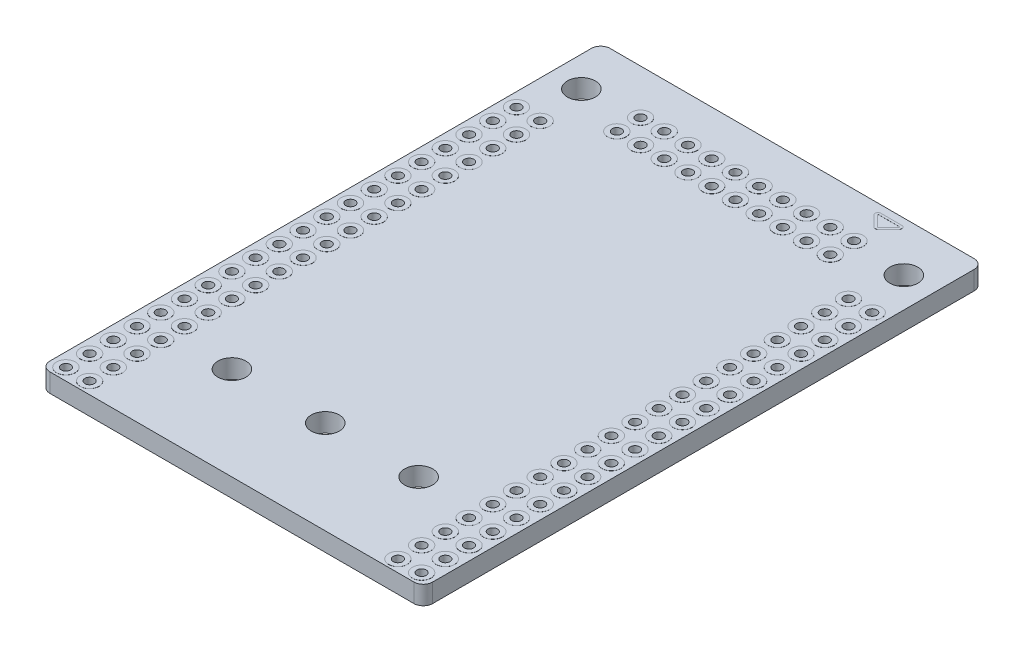
from build123d import *

# Parameters (mm, degrees)
BOSS_EXTRUDE1_DEPTH          = 2
SKETCH4_R                    = 1.5
CUT_EXTRUDE2_DEPTH           = 37.390245946
SKETCH2_R                    = 1
SKETCH2_R_2                  = 0.5
BOSS_EXTRUDE2_DEPTH          = 0.01
SKETCH3_R                    = 0.5
CUT_EXTRUDE1_DEPTH           = 37.390245946
LPATTERN3_COUNT              = 2
LPATTERN3_PITCH              = 2.54
LPATTERN4_COPY_1_SKETCH_R    = 1
LPATTERN4_COPY_1_SKETCH_R_2  = 0.5
LPATTERN4_COPY_1_DEPTH       = 0.01
LPATTERN4_COPY_2_SKETCH_R    = 1
LPATTERN4_COPY_2_SKETCH_R_2  = 0.5
LPATTERN4_COPY_2_DEPTH       = 0.01
LPATTERN4_COPY_3_SKETCH_R    = 1
LPATTERN4_COPY_3_SKETCH_R_2  = 0.5
LPATTERN4_COPY_3_DEPTH       = 0.01
LPATTERN4_COPY_4_SKETCH_R    = 1
LPATTERN4_COPY_4_SKETCH_R_2  = 0.5
LPATTERN4_COPY_4_DEPTH       = 0.01
LPATTERN4_COPY_5_SKETCH_R    = 0.5
LPATTERN4_COPY_5_DEPTH       = 37.390245946
LPATTERN4_COPY_6_SKETCH_R    = 0.5
LPATTERN4_COPY_6_DEPTH       = 37.390245946
LPATTERN4_COPY_7_SKETCH_R    = 0.5
LPATTERN4_COPY_7_DEPTH       = 37.390245946
LPATTERN4_COPY_8_SKETCH_R    = 0.5
LPATTERN4_COPY_8_DEPTH       = 37.390245946
LPATTERN4_COPY_9_SKETCH_R    = 1
LPATTERN4_COPY_9_SKETCH_R_2  = 0.5
LPATTERN4_COPY_9_DEPTH       = 0.01
LPATTERN4_COPY_10_SKETCH_R   = 1
LPATTERN4_COPY_10_SKETCH_R_2 = 0.5
LPATTERN4_COPY_10_DEPTH      = 0.01
LPATTERN4_COPY_11_SKETCH_R   = 1
LPATTERN4_COPY_11_SKETCH_R_2 = 0.5
LPATTERN4_COPY_11_DEPTH      = 0.01
LPATTERN4_COPY_12_SKETCH_R   = 1
LPATTERN4_COPY_12_SKETCH_R_2 = 0.5
LPATTERN4_COPY_12_DEPTH      = 0.01
LPATTERN4_COPY_13_SKETCH_R   = 0.5
LPATTERN4_COPY_13_DEPTH      = 37.390245946
LPATTERN4_COPY_14_SKETCH_R   = 0.5
LPATTERN4_COPY_14_DEPTH      = 37.390245946
LPATTERN4_COPY_15_SKETCH_R   = 0.5
LPATTERN4_COPY_15_DEPTH      = 37.390245946
LPATTERN4_COPY_16_SKETCH_R   = 0.5
LPATTERN4_COPY_16_DEPTH      = 37.390245946
LPATTERN5_COPY_1_SKETCH_R    = 1
LPATTERN5_COPY_1_SKETCH_R_2  = 0.5
LPATTERN5_COPY_1_DEPTH       = 0.01
LPATTERN5_COPY_2_SKETCH_R    = 1
LPATTERN5_COPY_2_SKETCH_R_2  = 0.5
LPATTERN5_COPY_2_DEPTH       = 0.01
LPATTERN5_COPY_3_SKETCH_R    = 1
LPATTERN5_COPY_3_SKETCH_R_2  = 0.5
LPATTERN5_COPY_3_DEPTH       = 0.01
LPATTERN5_COPY_4_SKETCH_R    = 1
LPATTERN5_COPY_4_SKETCH_R_2  = 0.5
LPATTERN5_COPY_4_DEPTH       = 0.01
LPATTERN5_COPY_5_SKETCH_R    = 1
LPATTERN5_COPY_5_SKETCH_R_2  = 0.5
LPATTERN5_COPY_5_DEPTH       = 0.01
LPATTERN5_COPY_6_SKETCH_R    = 0.5
LPATTERN5_COPY_6_DEPTH       = 37.390245946
LPATTERN5_COPY_7_SKETCH_R    = 0.5
LPATTERN5_COPY_7_DEPTH       = 37.390245946
LPATTERN5_COPY_8_SKETCH_R    = 0.5
LPATTERN5_COPY_8_DEPTH       = 37.390245946
LPATTERN5_COPY_9_SKETCH_R    = 0.5
LPATTERN5_COPY_9_DEPTH       = 37.390245946
LPATTERN5_COPY_10_SKETCH_R   = 0.5
LPATTERN5_COPY_10_DEPTH      = 37.390245946
LPATTERN5_COPY_11_SKETCH_R   = 1
LPATTERN5_COPY_11_SKETCH_R_2 = 0.5
LPATTERN5_COPY_11_DEPTH      = 0.01
LPATTERN5_COPY_12_SKETCH_R   = 1
LPATTERN5_COPY_12_SKETCH_R_2 = 0.5
LPATTERN5_COPY_12_DEPTH      = 0.01
LPATTERN5_COPY_13_SKETCH_R   = 1
LPATTERN5_COPY_13_SKETCH_R_2 = 0.5
LPATTERN5_COPY_13_DEPTH      = 0.01
LPATTERN5_COPY_14_SKETCH_R   = 1
LPATTERN5_COPY_14_SKETCH_R_2 = 0.5
LPATTERN5_COPY_14_DEPTH      = 0.01
LPATTERN5_COPY_15_SKETCH_R   = 1
LPATTERN5_COPY_15_SKETCH_R_2 = 0.5
LPATTERN5_COPY_15_DEPTH      = 0.01
LPATTERN5_COPY_16_SKETCH_R   = 0.5
LPATTERN5_COPY_16_DEPTH      = 37.390245946
LPATTERN5_COPY_17_SKETCH_R   = 0.5
LPATTERN5_COPY_17_DEPTH      = 37.390245946
LPATTERN5_COPY_18_SKETCH_R   = 0.5
LPATTERN5_COPY_18_DEPTH      = 37.390245946
LPATTERN5_COPY_19_SKETCH_R   = 0.5
LPATTERN5_COPY_19_DEPTH      = 37.390245946
LPATTERN5_COPY_20_SKETCH_R   = 0.5
LPATTERN5_COPY_20_DEPTH      = 37.390245946
SKETCH5_R                    = 1
SKETCH5_R_2                  = 0.5
BOSS_EXTRUDE3_DEPTH          = 0.01
SKETCH6_R                    = 0.5
CUT_EXTRUDE3_DEPTH           = 37.390245946
LPATTERN6_COUNT              = 2
LPATTERN6_PITCH              = 2.54
LPATTERN7_COPY_1_SKETCH_R    = 1
LPATTERN7_COPY_1_SKETCH_R_2  = 0.5
LPATTERN7_COPY_1_DEPTH       = 0.01
LPATTERN7_COPY_2_SKETCH_R    = 1
LPATTERN7_COPY_2_SKETCH_R_2  = 0.5
LPATTERN7_COPY_2_DEPTH       = 0.01
LPATTERN7_COPY_3_SKETCH_R    = 1
LPATTERN7_COPY_3_SKETCH_R_2  = 0.5
LPATTERN7_COPY_3_DEPTH       = 0.01
LPATTERN7_COPY_4_SKETCH_R    = 1
LPATTERN7_COPY_4_SKETCH_R_2  = 0.5
LPATTERN7_COPY_4_DEPTH       = 0.01
LPATTERN7_COPY_5_SKETCH_R    = 1
LPATTERN7_COPY_5_SKETCH_R_2  = 0.5
LPATTERN7_COPY_5_DEPTH       = 0.01
LPATTERN7_COPY_6_SKETCH_R    = 1
LPATTERN7_COPY_6_SKETCH_R_2  = 0.5
LPATTERN7_COPY_6_DEPTH       = 0.01
LPATTERN7_COPY_7_SKETCH_R    = 1
LPATTERN7_COPY_7_SKETCH_R_2  = 0.5
LPATTERN7_COPY_7_DEPTH       = 0.01
LPATTERN7_COPY_8_SKETCH_R    = 1
LPATTERN7_COPY_8_SKETCH_R_2  = 0.5
LPATTERN7_COPY_8_DEPTH       = 0.01
LPATTERN7_COPY_9_SKETCH_R    = 1
LPATTERN7_COPY_9_SKETCH_R_2  = 0.5
LPATTERN7_COPY_9_DEPTH       = 0.01
LPATTERN7_COPY_10_SKETCH_R   = 1
LPATTERN7_COPY_10_SKETCH_R_2 = 0.5
LPATTERN7_COPY_10_DEPTH      = 0.01
LPATTERN7_COPY_11_SKETCH_R   = 1
LPATTERN7_COPY_11_SKETCH_R_2 = 0.5
LPATTERN7_COPY_11_DEPTH      = 0.01
LPATTERN7_COPY_12_SKETCH_R   = 1
LPATTERN7_COPY_12_SKETCH_R_2 = 0.5
LPATTERN7_COPY_12_DEPTH      = 0.01
LPATTERN7_COPY_13_SKETCH_R   = 1
LPATTERN7_COPY_13_SKETCH_R_2 = 0.5
LPATTERN7_COPY_13_DEPTH      = 0.01
LPATTERN7_COPY_14_SKETCH_R   = 1
LPATTERN7_COPY_14_SKETCH_R_2 = 0.5
LPATTERN7_COPY_14_DEPTH      = 0.01
LPATTERN7_COPY_15_SKETCH_R   = 1
LPATTERN7_COPY_15_SKETCH_R_2 = 0.5
LPATTERN7_COPY_15_DEPTH      = 0.01
LPATTERN7_COPY_16_SKETCH_R   = 1
LPATTERN7_COPY_16_SKETCH_R_2 = 0.5
LPATTERN7_COPY_16_DEPTH      = 0.01
LPATTERN7_COPY_17_SKETCH_R   = 1
LPATTERN7_COPY_17_SKETCH_R_2 = 0.5
LPATTERN7_COPY_17_DEPTH      = 0.01
LPATTERN7_COPY_18_SKETCH_R   = 1
LPATTERN7_COPY_18_SKETCH_R_2 = 0.5
LPATTERN7_COPY_18_DEPTH      = 0.01
LPATTERN7_COPY_19_SKETCH_R   = 1
LPATTERN7_COPY_19_SKETCH_R_2 = 0.5
LPATTERN7_COPY_19_DEPTH      = 0.01
LPATTERN7_COPY_20_SKETCH_R   = 0.5
LPATTERN7_COPY_20_DEPTH      = 37.390245946
LPATTERN7_COPY_21_SKETCH_R   = 0.5
LPATTERN7_COPY_21_DEPTH      = 37.390245946
LPATTERN7_COPY_22_SKETCH_R   = 0.5
LPATTERN7_COPY_22_DEPTH      = 37.390245946
LPATTERN7_COPY_23_SKETCH_R   = 0.5
LPATTERN7_COPY_23_DEPTH      = 37.390245946
LPATTERN7_COPY_24_SKETCH_R   = 0.5
LPATTERN7_COPY_24_DEPTH      = 37.390245946
LPATTERN7_COPY_25_SKETCH_R   = 0.5
LPATTERN7_COPY_25_DEPTH      = 37.390245946
LPATTERN7_COPY_26_SKETCH_R   = 0.5
LPATTERN7_COPY_26_DEPTH      = 37.390245946
LPATTERN7_COPY_27_SKETCH_R   = 0.5
LPATTERN7_COPY_27_DEPTH      = 37.390245946
LPATTERN7_COPY_28_SKETCH_R   = 0.5
LPATTERN7_COPY_28_DEPTH      = 37.390245946
LPATTERN7_COPY_29_SKETCH_R   = 0.5
LPATTERN7_COPY_29_DEPTH      = 37.390245946
LPATTERN7_COPY_30_SKETCH_R   = 0.5
LPATTERN7_COPY_30_DEPTH      = 37.390245946
LPATTERN7_COPY_31_SKETCH_R   = 0.5
LPATTERN7_COPY_31_DEPTH      = 37.390245946
LPATTERN7_COPY_32_SKETCH_R   = 0.5
LPATTERN7_COPY_32_DEPTH      = 37.390245946
LPATTERN7_COPY_33_SKETCH_R   = 0.5
LPATTERN7_COPY_33_DEPTH      = 37.390245946
LPATTERN7_COPY_34_SKETCH_R   = 0.5
LPATTERN7_COPY_34_DEPTH      = 37.390245946
LPATTERN7_COPY_35_SKETCH_R   = 0.5
LPATTERN7_COPY_35_DEPTH      = 37.390245946
LPATTERN7_COPY_36_SKETCH_R   = 0.5
LPATTERN7_COPY_36_DEPTH      = 37.390245946
LPATTERN7_COPY_37_SKETCH_R   = 0.5
LPATTERN7_COPY_37_DEPTH      = 37.390245946
LPATTERN7_COPY_38_SKETCH_R   = 0.5
LPATTERN7_COPY_38_DEPTH      = 37.390245946
LPATTERN7_COPY_39_SKETCH_R   = 1
LPATTERN7_COPY_39_SKETCH_R_2 = 0.5
LPATTERN7_COPY_39_DEPTH      = 0.01
LPATTERN7_COPY_40_SKETCH_R   = 1
LPATTERN7_COPY_40_SKETCH_R_2 = 0.5
LPATTERN7_COPY_40_DEPTH      = 0.01
LPATTERN7_COPY_41_SKETCH_R   = 1
LPATTERN7_COPY_41_SKETCH_R_2 = 0.5
LPATTERN7_COPY_41_DEPTH      = 0.01
LPATTERN7_COPY_42_SKETCH_R   = 1
LPATTERN7_COPY_42_SKETCH_R_2 = 0.5
LPATTERN7_COPY_42_DEPTH      = 0.01
LPATTERN7_COPY_43_SKETCH_R   = 1
LPATTERN7_COPY_43_SKETCH_R_2 = 0.5
LPATTERN7_COPY_43_DEPTH      = 0.01
LPATTERN7_COPY_44_SKETCH_R   = 1
LPATTERN7_COPY_44_SKETCH_R_2 = 0.5
LPATTERN7_COPY_44_DEPTH      = 0.01
LPATTERN7_COPY_45_SKETCH_R   = 1
LPATTERN7_COPY_45_SKETCH_R_2 = 0.5
LPATTERN7_COPY_45_DEPTH      = 0.01
LPATTERN7_COPY_46_SKETCH_R   = 1
LPATTERN7_COPY_46_SKETCH_R_2 = 0.5
LPATTERN7_COPY_46_DEPTH      = 0.01
LPATTERN7_COPY_47_SKETCH_R   = 1
LPATTERN7_COPY_47_SKETCH_R_2 = 0.5
LPATTERN7_COPY_47_DEPTH      = 0.01
LPATTERN7_COPY_48_SKETCH_R   = 1
LPATTERN7_COPY_48_SKETCH_R_2 = 0.5
LPATTERN7_COPY_48_DEPTH      = 0.01
LPATTERN7_COPY_49_SKETCH_R   = 1
LPATTERN7_COPY_49_SKETCH_R_2 = 0.5
LPATTERN7_COPY_49_DEPTH      = 0.01
LPATTERN7_COPY_50_SKETCH_R   = 1
LPATTERN7_COPY_50_SKETCH_R_2 = 0.5
LPATTERN7_COPY_50_DEPTH      = 0.01
LPATTERN7_COPY_51_SKETCH_R   = 1
LPATTERN7_COPY_51_SKETCH_R_2 = 0.5
LPATTERN7_COPY_51_DEPTH      = 0.01
LPATTERN7_COPY_52_SKETCH_R   = 1
LPATTERN7_COPY_52_SKETCH_R_2 = 0.5
LPATTERN7_COPY_52_DEPTH      = 0.01
LPATTERN7_COPY_53_SKETCH_R   = 1
LPATTERN7_COPY_53_SKETCH_R_2 = 0.5
LPATTERN7_COPY_53_DEPTH      = 0.01
LPATTERN7_COPY_54_SKETCH_R   = 1
LPATTERN7_COPY_54_SKETCH_R_2 = 0.5
LPATTERN7_COPY_54_DEPTH      = 0.01
LPATTERN7_COPY_55_SKETCH_R   = 1
LPATTERN7_COPY_55_SKETCH_R_2 = 0.5
LPATTERN7_COPY_55_DEPTH      = 0.01
LPATTERN7_COPY_56_SKETCH_R   = 1
LPATTERN7_COPY_56_SKETCH_R_2 = 0.5
LPATTERN7_COPY_56_DEPTH      = 0.01
LPATTERN7_COPY_57_SKETCH_R   = 1
LPATTERN7_COPY_57_SKETCH_R_2 = 0.5
LPATTERN7_COPY_57_DEPTH      = 0.01
LPATTERN7_COPY_58_SKETCH_R   = 0.5
LPATTERN7_COPY_58_DEPTH      = 37.390245946
LPATTERN7_COPY_59_SKETCH_R   = 0.5
LPATTERN7_COPY_59_DEPTH      = 37.390245946
LPATTERN7_COPY_60_SKETCH_R   = 0.5
LPATTERN7_COPY_60_DEPTH      = 37.390245946
LPATTERN7_COPY_61_SKETCH_R   = 0.5
LPATTERN7_COPY_61_DEPTH      = 37.390245946
LPATTERN7_COPY_62_SKETCH_R   = 0.5
LPATTERN7_COPY_62_DEPTH      = 37.390245946
LPATTERN7_COPY_63_SKETCH_R   = 0.5
LPATTERN7_COPY_63_DEPTH      = 37.390245946
LPATTERN7_COPY_64_SKETCH_R   = 0.5
LPATTERN7_COPY_64_DEPTH      = 37.390245946
LPATTERN7_COPY_65_SKETCH_R   = 0.5
LPATTERN7_COPY_65_DEPTH      = 37.390245946
LPATTERN7_COPY_66_SKETCH_R   = 0.5
LPATTERN7_COPY_66_DEPTH      = 37.390245946
LPATTERN7_COPY_67_SKETCH_R   = 0.5
LPATTERN7_COPY_67_DEPTH      = 37.390245946
LPATTERN7_COPY_68_SKETCH_R   = 0.5
LPATTERN7_COPY_68_DEPTH      = 37.390245946
LPATTERN7_COPY_69_SKETCH_R   = 0.5
LPATTERN7_COPY_69_DEPTH      = 37.390245946
LPATTERN7_COPY_70_SKETCH_R   = 0.5
LPATTERN7_COPY_70_DEPTH      = 37.390245946
LPATTERN7_COPY_71_SKETCH_R   = 0.5
LPATTERN7_COPY_71_DEPTH      = 37.390245946
LPATTERN7_COPY_72_SKETCH_R   = 0.5
LPATTERN7_COPY_72_DEPTH      = 37.390245946
LPATTERN7_COPY_73_SKETCH_R   = 0.5
LPATTERN7_COPY_73_DEPTH      = 37.390245946
LPATTERN7_COPY_74_SKETCH_R   = 0.5
LPATTERN7_COPY_74_DEPTH      = 37.390245946
LPATTERN7_COPY_75_SKETCH_R   = 0.5
LPATTERN7_COPY_75_DEPTH      = 37.390245946
LPATTERN7_COPY_76_SKETCH_R   = 0.5
LPATTERN7_COPY_76_DEPTH      = 37.390245946
SKETCH7_R                    = 1
SKETCH7_R_2                  = 0.5
BOSS_EXTRUDE4_DEPTH          = 0.01
SKETCH8_R                    = 0.5
CUT_EXTRUDE4_DEPTH           = 37.390245946
LPATTERN8_COUNT              = 2
LPATTERN8_PITCH              = 2.54
LPATTERN9_COPY_1_SKETCH_R    = 1
LPATTERN9_COPY_1_SKETCH_R_2  = 0.5
LPATTERN9_COPY_1_DEPTH       = 0.01
LPATTERN9_COPY_2_SKETCH_R    = 1
LPATTERN9_COPY_2_SKETCH_R_2  = 0.5
LPATTERN9_COPY_2_DEPTH       = 0.01
LPATTERN9_COPY_3_SKETCH_R    = 1
LPATTERN9_COPY_3_SKETCH_R_2  = 0.5
LPATTERN9_COPY_3_DEPTH       = 0.01
LPATTERN9_COPY_4_SKETCH_R    = 1
LPATTERN9_COPY_4_SKETCH_R_2  = 0.5
LPATTERN9_COPY_4_DEPTH       = 0.01
LPATTERN9_COPY_5_SKETCH_R    = 1
LPATTERN9_COPY_5_SKETCH_R_2  = 0.5
LPATTERN9_COPY_5_DEPTH       = 0.01
LPATTERN9_COPY_6_SKETCH_R    = 1
LPATTERN9_COPY_6_SKETCH_R_2  = 0.5
LPATTERN9_COPY_6_DEPTH       = 0.01
LPATTERN9_COPY_7_SKETCH_R    = 1
LPATTERN9_COPY_7_SKETCH_R_2  = 0.5
LPATTERN9_COPY_7_DEPTH       = 0.01
LPATTERN9_COPY_8_SKETCH_R    = 1
LPATTERN9_COPY_8_SKETCH_R_2  = 0.5
LPATTERN9_COPY_8_DEPTH       = 0.01
LPATTERN9_COPY_9_SKETCH_R    = 1
LPATTERN9_COPY_9_SKETCH_R_2  = 0.5
LPATTERN9_COPY_9_DEPTH       = 0.01
LPATTERN9_COPY_10_SKETCH_R   = 1
LPATTERN9_COPY_10_SKETCH_R_2 = 0.5
LPATTERN9_COPY_10_DEPTH      = 0.01
LPATTERN9_COPY_11_SKETCH_R   = 1
LPATTERN9_COPY_11_SKETCH_R_2 = 0.5
LPATTERN9_COPY_11_DEPTH      = 0.01
LPATTERN9_COPY_12_SKETCH_R   = 1
LPATTERN9_COPY_12_SKETCH_R_2 = 0.5
LPATTERN9_COPY_12_DEPTH      = 0.01
LPATTERN9_COPY_13_SKETCH_R   = 1
LPATTERN9_COPY_13_SKETCH_R_2 = 0.5
LPATTERN9_COPY_13_DEPTH      = 0.01
LPATTERN9_COPY_14_SKETCH_R   = 1
LPATTERN9_COPY_14_SKETCH_R_2 = 0.5
LPATTERN9_COPY_14_DEPTH      = 0.01
LPATTERN9_COPY_15_SKETCH_R   = 1
LPATTERN9_COPY_15_SKETCH_R_2 = 0.5
LPATTERN9_COPY_15_DEPTH      = 0.01
LPATTERN9_COPY_16_SKETCH_R   = 1
LPATTERN9_COPY_16_SKETCH_R_2 = 0.5
LPATTERN9_COPY_16_DEPTH      = 0.01
LPATTERN9_COPY_17_SKETCH_R   = 1
LPATTERN9_COPY_17_SKETCH_R_2 = 0.5
LPATTERN9_COPY_17_DEPTH      = 0.01
LPATTERN9_COPY_18_SKETCH_R   = 1
LPATTERN9_COPY_18_SKETCH_R_2 = 0.5
LPATTERN9_COPY_18_DEPTH      = 0.01
LPATTERN9_COPY_19_SKETCH_R   = 1
LPATTERN9_COPY_19_SKETCH_R_2 = 0.5
LPATTERN9_COPY_19_DEPTH      = 0.01
LPATTERN9_COPY_20_SKETCH_R   = 0.5
LPATTERN9_COPY_20_DEPTH      = 37.390245946
LPATTERN9_COPY_21_SKETCH_R   = 0.5
LPATTERN9_COPY_21_DEPTH      = 37.390245946
LPATTERN9_COPY_22_SKETCH_R   = 0.5
LPATTERN9_COPY_22_DEPTH      = 37.390245946
LPATTERN9_COPY_23_SKETCH_R   = 0.5
LPATTERN9_COPY_23_DEPTH      = 37.390245946
LPATTERN9_COPY_24_SKETCH_R   = 0.5
LPATTERN9_COPY_24_DEPTH      = 37.390245946
LPATTERN9_COPY_25_SKETCH_R   = 0.5
LPATTERN9_COPY_25_DEPTH      = 37.390245946
LPATTERN9_COPY_26_SKETCH_R   = 0.5
LPATTERN9_COPY_26_DEPTH      = 37.390245946
LPATTERN9_COPY_27_SKETCH_R   = 0.5
LPATTERN9_COPY_27_DEPTH      = 37.390245946
LPATTERN9_COPY_28_SKETCH_R   = 0.5
LPATTERN9_COPY_28_DEPTH      = 37.390245946
LPATTERN9_COPY_29_SKETCH_R   = 0.5
LPATTERN9_COPY_29_DEPTH      = 37.390245946
LPATTERN9_COPY_30_SKETCH_R   = 0.5
LPATTERN9_COPY_30_DEPTH      = 37.390245946
LPATTERN9_COPY_31_SKETCH_R   = 0.5
LPATTERN9_COPY_31_DEPTH      = 37.390245946
LPATTERN9_COPY_32_SKETCH_R   = 0.5
LPATTERN9_COPY_32_DEPTH      = 37.390245946
LPATTERN9_COPY_33_SKETCH_R   = 0.5
LPATTERN9_COPY_33_DEPTH      = 37.390245946
LPATTERN9_COPY_34_SKETCH_R   = 0.5
LPATTERN9_COPY_34_DEPTH      = 37.390245946
LPATTERN9_COPY_35_SKETCH_R   = 0.5
LPATTERN9_COPY_35_DEPTH      = 37.390245946
LPATTERN9_COPY_36_SKETCH_R   = 0.5
LPATTERN9_COPY_36_DEPTH      = 37.390245946
LPATTERN9_COPY_37_SKETCH_R   = 0.5
LPATTERN9_COPY_37_DEPTH      = 37.390245946
LPATTERN9_COPY_38_SKETCH_R   = 0.5
LPATTERN9_COPY_38_DEPTH      = 37.390245946
LPATTERN9_COPY_39_SKETCH_R   = 1
LPATTERN9_COPY_39_SKETCH_R_2 = 0.5
LPATTERN9_COPY_39_DEPTH      = 0.01
LPATTERN9_COPY_40_SKETCH_R   = 1
LPATTERN9_COPY_40_SKETCH_R_2 = 0.5
LPATTERN9_COPY_40_DEPTH      = 0.01
LPATTERN9_COPY_41_SKETCH_R   = 1
LPATTERN9_COPY_41_SKETCH_R_2 = 0.5
LPATTERN9_COPY_41_DEPTH      = 0.01
LPATTERN9_COPY_42_SKETCH_R   = 1
LPATTERN9_COPY_42_SKETCH_R_2 = 0.5
LPATTERN9_COPY_42_DEPTH      = 0.01
LPATTERN9_COPY_43_SKETCH_R   = 1
LPATTERN9_COPY_43_SKETCH_R_2 = 0.5
LPATTERN9_COPY_43_DEPTH      = 0.01
LPATTERN9_COPY_44_SKETCH_R   = 1
LPATTERN9_COPY_44_SKETCH_R_2 = 0.5
LPATTERN9_COPY_44_DEPTH      = 0.01
LPATTERN9_COPY_45_SKETCH_R   = 1
LPATTERN9_COPY_45_SKETCH_R_2 = 0.5
LPATTERN9_COPY_45_DEPTH      = 0.01
LPATTERN9_COPY_46_SKETCH_R   = 1
LPATTERN9_COPY_46_SKETCH_R_2 = 0.5
LPATTERN9_COPY_46_DEPTH      = 0.01
LPATTERN9_COPY_47_SKETCH_R   = 1
LPATTERN9_COPY_47_SKETCH_R_2 = 0.5
LPATTERN9_COPY_47_DEPTH      = 0.01
LPATTERN9_COPY_48_SKETCH_R   = 1
LPATTERN9_COPY_48_SKETCH_R_2 = 0.5
LPATTERN9_COPY_48_DEPTH      = 0.01
LPATTERN9_COPY_49_SKETCH_R   = 1
LPATTERN9_COPY_49_SKETCH_R_2 = 0.5
LPATTERN9_COPY_49_DEPTH      = 0.01
LPATTERN9_COPY_50_SKETCH_R   = 1
LPATTERN9_COPY_50_SKETCH_R_2 = 0.5
LPATTERN9_COPY_50_DEPTH      = 0.01
LPATTERN9_COPY_51_SKETCH_R   = 1
LPATTERN9_COPY_51_SKETCH_R_2 = 0.5
LPATTERN9_COPY_51_DEPTH      = 0.01
LPATTERN9_COPY_52_SKETCH_R   = 1
LPATTERN9_COPY_52_SKETCH_R_2 = 0.5
LPATTERN9_COPY_52_DEPTH      = 0.01
LPATTERN9_COPY_53_SKETCH_R   = 1
LPATTERN9_COPY_53_SKETCH_R_2 = 0.5
LPATTERN9_COPY_53_DEPTH      = 0.01
LPATTERN9_COPY_54_SKETCH_R   = 1
LPATTERN9_COPY_54_SKETCH_R_2 = 0.5
LPATTERN9_COPY_54_DEPTH      = 0.01
LPATTERN9_COPY_55_SKETCH_R   = 1
LPATTERN9_COPY_55_SKETCH_R_2 = 0.5
LPATTERN9_COPY_55_DEPTH      = 0.01
LPATTERN9_COPY_56_SKETCH_R   = 1
LPATTERN9_COPY_56_SKETCH_R_2 = 0.5
LPATTERN9_COPY_56_DEPTH      = 0.01
LPATTERN9_COPY_57_SKETCH_R   = 1
LPATTERN9_COPY_57_SKETCH_R_2 = 0.5
LPATTERN9_COPY_57_DEPTH      = 0.01
LPATTERN9_COPY_58_SKETCH_R   = 0.5
LPATTERN9_COPY_58_DEPTH      = 37.390245946
LPATTERN9_COPY_59_SKETCH_R   = 0.5
LPATTERN9_COPY_59_DEPTH      = 37.390245946
LPATTERN9_COPY_60_SKETCH_R   = 0.5
LPATTERN9_COPY_60_DEPTH      = 37.390245946
LPATTERN9_COPY_61_SKETCH_R   = 0.5
LPATTERN9_COPY_61_DEPTH      = 37.390245946
LPATTERN9_COPY_62_SKETCH_R   = 0.5
LPATTERN9_COPY_62_DEPTH      = 37.390245946
LPATTERN9_COPY_63_SKETCH_R   = 0.5
LPATTERN9_COPY_63_DEPTH      = 37.390245946
LPATTERN9_COPY_64_SKETCH_R   = 0.5
LPATTERN9_COPY_64_DEPTH      = 37.390245946
LPATTERN9_COPY_65_SKETCH_R   = 0.5
LPATTERN9_COPY_65_DEPTH      = 37.390245946
LPATTERN9_COPY_66_SKETCH_R   = 0.5
LPATTERN9_COPY_66_DEPTH      = 37.390245946
LPATTERN9_COPY_67_SKETCH_R   = 0.5
LPATTERN9_COPY_67_DEPTH      = 37.390245946
LPATTERN9_COPY_68_SKETCH_R   = 0.5
LPATTERN9_COPY_68_DEPTH      = 37.390245946
LPATTERN9_COPY_69_SKETCH_R   = 0.5
LPATTERN9_COPY_69_DEPTH      = 37.390245946
LPATTERN9_COPY_70_SKETCH_R   = 0.5
LPATTERN9_COPY_70_DEPTH      = 37.390245946
LPATTERN9_COPY_71_SKETCH_R   = 0.5
LPATTERN9_COPY_71_DEPTH      = 37.390245946
LPATTERN9_COPY_72_SKETCH_R   = 0.5
LPATTERN9_COPY_72_DEPTH      = 37.390245946
LPATTERN9_COPY_73_SKETCH_R   = 0.5
LPATTERN9_COPY_73_DEPTH      = 37.390245946
LPATTERN9_COPY_74_SKETCH_R   = 0.5
LPATTERN9_COPY_74_DEPTH      = 37.390245946
LPATTERN9_COPY_75_SKETCH_R   = 0.5
LPATTERN9_COPY_75_DEPTH      = 37.390245946
LPATTERN9_COPY_76_SKETCH_R   = 0.5
LPATTERN9_COPY_76_DEPTH      = 37.390245946
BOSS_EXTRUDE5_DEPTH          = 0.01
SKETCH11_R                   = 1.5
CUT_EXTRUDE5_DEPTH           = 37.390245946


with BuildPart() as part:
    # Sketch1 → Boss-Extrude1 (new body)
    with BuildSketch(Plane(origin=(0, 0, 0), x_dir=(1, 0, 0), z_dir=(0, 1, 0))):
        with BuildLine():
            Line((-19.5, -30), (19.5, -30))
            ThreePointArc((19.5, -30), (20.207106781, -29.707106781), (20.5, -29))
            Line((20.5, -29), (20.5, 29))
            ThreePointArc((20.5, 29), (20.207106781, 29.707106781), (19.5, 30))
            Line((19.5, 30), (-19.5, 30))
            ThreePointArc((-19.5, 30), (-20.207106781, 29.707106781), (-20.5, 29))
            Line((-20.5, 29), (-20.5, -29))
            ThreePointArc((-20.5, -29), (-20.207106781, -29.707106781), (-19.5, -30))
        make_face()
    extrude(amount=BOSS_EXTRUDE1_DEPTH)

    # Sketch4 → Cut-Extrude2 (cut, through all)
    with BuildSketch(Plane(origin=(0, 2, 0), x_dir=(1, 0, 0), z_dir=(0, 1, 0))):
        with Locations((0, -20)):
            Circle(SKETCH4_R)
        with Locations((-10, -20)):
            Circle(SKETCH4_R)
        with Locations((10, -20)):
            Circle(SKETCH4_R)
    extrude(amount=-CUT_EXTRUDE2_DEPTH, mode=Mode.SUBTRACT)

    # Sketch2 → Boss-Extrude2 (add)
    with BuildSketch(Plane(origin=(0, 2, 0), x_dir=(1, 0, 0), z_dir=(0, 1, 0))):
        with Locations((-1.27, 25.2)):
            Circle(SKETCH2_R)
        with Locations((-1.27, 25.2)):
            Circle(SKETCH2_R_2, mode=Mode.SUBTRACT)
    boss_extrude2 = extrude(amount=BOSS_EXTRUDE2_DEPTH)

    # Sketch3 → Cut-Extrude1 (cut, symmetric)
    with BuildSketch(Plane(origin=(0, 2, 0), x_dir=(1, 0, 0), z_dir=(0, 1, 0))):
        with Locations((-1.27, 25.2)):
            Circle(SKETCH3_R)
    cut_extrude1 = extrude(amount=CUT_EXTRUDE1_DEPTH, both=True, mode=Mode.SUBTRACT)

    # LPattern3: Boss-Extrude2, Cut-Extrude1 ×2
    with Locations(*[(0, 0, i * LPATTERN3_PITCH) for i in range(1, LPATTERN3_COUNT)]):
        add(boss_extrude2)
        add(cut_extrude1, mode=Mode.SUBTRACT)

    # LPattern4 copy 1 sketch → LPattern4 copy 1 (add)
    with BuildSketch(Plane(origin=(-2.54, 2, 2.54), x_dir=(1, 0, 0), z_dir=(0, 1, 0))):
        with Locations((-1.27, 25.2)):
            Circle(LPATTERN4_COPY_1_SKETCH_R)
        with Locations((-1.27, 25.2)):
            Circle(LPATTERN4_COPY_1_SKETCH_R_2, mode=Mode.SUBTRACT)
    extrude(amount=LPATTERN4_COPY_1_DEPTH)

    # LPattern4 copy 2 sketch → LPattern4 copy 2 (add)
    with BuildSketch(Plane(origin=(-5.08, 2, 2.54), x_dir=(1, 0, 0), z_dir=(0, 1, 0))):
        with Locations((-1.27, 25.2)):
            Circle(LPATTERN4_COPY_2_SKETCH_R)
        with Locations((-1.27, 25.2)):
            Circle(LPATTERN4_COPY_2_SKETCH_R_2, mode=Mode.SUBTRACT)
    extrude(amount=LPATTERN4_COPY_2_DEPTH)

    # LPattern4 copy 3 sketch → LPattern4 copy 3 (add)
    with BuildSketch(Plane(origin=(-7.62, 2, 2.54), x_dir=(1, 0, 0), z_dir=(0, 1, 0))):
        with Locations((-1.27, 25.2)):
            Circle(LPATTERN4_COPY_3_SKETCH_R)
        with Locations((-1.27, 25.2)):
            Circle(LPATTERN4_COPY_3_SKETCH_R_2, mode=Mode.SUBTRACT)
    extrude(amount=LPATTERN4_COPY_3_DEPTH)

    # LPattern4 copy 4 sketch → LPattern4 copy 4 (add)
    with BuildSketch(Plane(origin=(-10.16, 2, 2.54), x_dir=(1, 0, 0), z_dir=(0, 1, 0))):
        with Locations((-1.27, 25.2)):
            Circle(LPATTERN4_COPY_4_SKETCH_R)
        with Locations((-1.27, 25.2)):
            Circle(LPATTERN4_COPY_4_SKETCH_R_2, mode=Mode.SUBTRACT)
    extrude(amount=LPATTERN4_COPY_4_DEPTH)

    # LPattern4 copy 5 sketch → LPattern4 copy 5 (cut, symmetric)
    with BuildSketch(Plane(origin=(-2.54, 2, 2.54), x_dir=(1, 0, 0), z_dir=(0, 1, 0))):
        with Locations((-1.27, 25.2)):
            Circle(LPATTERN4_COPY_5_SKETCH_R)
    extrude(amount=LPATTERN4_COPY_5_DEPTH, both=True, mode=Mode.SUBTRACT)

    # LPattern4 copy 6 sketch → LPattern4 copy 6 (cut, symmetric)
    with BuildSketch(Plane(origin=(-5.08, 2, 2.54), x_dir=(1, 0, 0), z_dir=(0, 1, 0))):
        with Locations((-1.27, 25.2)):
            Circle(LPATTERN4_COPY_6_SKETCH_R)
    extrude(amount=LPATTERN4_COPY_6_DEPTH, both=True, mode=Mode.SUBTRACT)

    # LPattern4 copy 7 sketch → LPattern4 copy 7 (cut, symmetric)
    with BuildSketch(Plane(origin=(-7.62, 2, 2.54), x_dir=(1, 0, 0), z_dir=(0, 1, 0))):
        with Locations((-1.27, 25.2)):
            Circle(LPATTERN4_COPY_7_SKETCH_R)
    extrude(amount=LPATTERN4_COPY_7_DEPTH, both=True, mode=Mode.SUBTRACT)

    # LPattern4 copy 8 sketch → LPattern4 copy 8 (cut, symmetric)
    with BuildSketch(Plane(origin=(-10.16, 2, 2.54), x_dir=(1, 0, 0), z_dir=(0, 1, 0))):
        with Locations((-1.27, 25.2)):
            Circle(LPATTERN4_COPY_8_SKETCH_R)
    extrude(amount=LPATTERN4_COPY_8_DEPTH, both=True, mode=Mode.SUBTRACT)

    # LPattern4 copy 9 sketch → LPattern4 copy 9 (add)
    with BuildSketch(Plane(origin=(-2.54, 2, 0), x_dir=(1, 0, 0), z_dir=(0, 1, 0))):
        with Locations((-1.27, 25.2)):
            Circle(LPATTERN4_COPY_9_SKETCH_R)
        with Locations((-1.27, 25.2)):
            Circle(LPATTERN4_COPY_9_SKETCH_R_2, mode=Mode.SUBTRACT)
    extrude(amount=LPATTERN4_COPY_9_DEPTH)

    # LPattern4 copy 10 sketch → LPattern4 copy 10 (add)
    with BuildSketch(Plane(origin=(-5.08, 2, 0), x_dir=(1, 0, 0), z_dir=(0, 1, 0))):
        with Locations((-1.27, 25.2)):
            Circle(LPATTERN4_COPY_10_SKETCH_R)
        with Locations((-1.27, 25.2)):
            Circle(LPATTERN4_COPY_10_SKETCH_R_2, mode=Mode.SUBTRACT)
    extrude(amount=LPATTERN4_COPY_10_DEPTH)

    # LPattern4 copy 11 sketch → LPattern4 copy 11 (add)
    with BuildSketch(Plane(origin=(-7.62, 2, 0), x_dir=(1, 0, 0), z_dir=(0, 1, 0))):
        with Locations((-1.27, 25.2)):
            Circle(LPATTERN4_COPY_11_SKETCH_R)
        with Locations((-1.27, 25.2)):
            Circle(LPATTERN4_COPY_11_SKETCH_R_2, mode=Mode.SUBTRACT)
    extrude(amount=LPATTERN4_COPY_11_DEPTH)

    # LPattern4 copy 12 sketch → LPattern4 copy 12 (add)
    with BuildSketch(Plane(origin=(-10.16, 2, 0), x_dir=(1, 0, 0), z_dir=(0, 1, 0))):
        with Locations((-1.27, 25.2)):
            Circle(LPATTERN4_COPY_12_SKETCH_R)
        with Locations((-1.27, 25.2)):
            Circle(LPATTERN4_COPY_12_SKETCH_R_2, mode=Mode.SUBTRACT)
    extrude(amount=LPATTERN4_COPY_12_DEPTH)

    # LPattern4 copy 13 sketch → LPattern4 copy 13 (cut, symmetric)
    with BuildSketch(Plane(origin=(-2.54, 2, 0), x_dir=(1, 0, 0), z_dir=(0, 1, 0))):
        with Locations((-1.27, 25.2)):
            Circle(LPATTERN4_COPY_13_SKETCH_R)
    extrude(amount=LPATTERN4_COPY_13_DEPTH, both=True, mode=Mode.SUBTRACT)

    # LPattern4 copy 14 sketch → LPattern4 copy 14 (cut, symmetric)
    with BuildSketch(Plane(origin=(-5.08, 2, 0), x_dir=(1, 0, 0), z_dir=(0, 1, 0))):
        with Locations((-1.27, 25.2)):
            Circle(LPATTERN4_COPY_14_SKETCH_R)
    extrude(amount=LPATTERN4_COPY_14_DEPTH, both=True, mode=Mode.SUBTRACT)

    # LPattern4 copy 15 sketch → LPattern4 copy 15 (cut, symmetric)
    with BuildSketch(Plane(origin=(-7.62, 2, 0), x_dir=(1, 0, 0), z_dir=(0, 1, 0))):
        with Locations((-1.27, 25.2)):
            Circle(LPATTERN4_COPY_15_SKETCH_R)
    extrude(amount=LPATTERN4_COPY_15_DEPTH, both=True, mode=Mode.SUBTRACT)

    # LPattern4 copy 16 sketch → LPattern4 copy 16 (cut, symmetric)
    with BuildSketch(Plane(origin=(-10.16, 2, 0), x_dir=(1, 0, 0), z_dir=(0, 1, 0))):
        with Locations((-1.27, 25.2)):
            Circle(LPATTERN4_COPY_16_SKETCH_R)
    extrude(amount=LPATTERN4_COPY_16_DEPTH, both=True, mode=Mode.SUBTRACT)

    # LPattern5 copy 1 sketch → LPattern5 copy 1 (add)
    with BuildSketch(Plane(origin=(2.54, 2, 2.54), x_dir=(1, 0, 0), z_dir=(0, 1, 0))):
        with Locations((-1.27, 25.2)):
            Circle(LPATTERN5_COPY_1_SKETCH_R)
        with Locations((-1.27, 25.2)):
            Circle(LPATTERN5_COPY_1_SKETCH_R_2, mode=Mode.SUBTRACT)
    extrude(amount=LPATTERN5_COPY_1_DEPTH)

    # LPattern5 copy 2 sketch → LPattern5 copy 2 (add)
    with BuildSketch(Plane(origin=(5.08, 2, 2.54), x_dir=(1, 0, 0), z_dir=(0, 1, 0))):
        with Locations((-1.27, 25.2)):
            Circle(LPATTERN5_COPY_2_SKETCH_R)
        with Locations((-1.27, 25.2)):
            Circle(LPATTERN5_COPY_2_SKETCH_R_2, mode=Mode.SUBTRACT)
    extrude(amount=LPATTERN5_COPY_2_DEPTH)

    # LPattern5 copy 3 sketch → LPattern5 copy 3 (add)
    with BuildSketch(Plane(origin=(7.62, 2, 2.54), x_dir=(1, 0, 0), z_dir=(0, 1, 0))):
        with Locations((-1.27, 25.2)):
            Circle(LPATTERN5_COPY_3_SKETCH_R)
        with Locations((-1.27, 25.2)):
            Circle(LPATTERN5_COPY_3_SKETCH_R_2, mode=Mode.SUBTRACT)
    extrude(amount=LPATTERN5_COPY_3_DEPTH)

    # LPattern5 copy 4 sketch → LPattern5 copy 4 (add)
    with BuildSketch(Plane(origin=(10.16, 2, 2.54), x_dir=(1, 0, 0), z_dir=(0, 1, 0))):
        with Locations((-1.27, 25.2)):
            Circle(LPATTERN5_COPY_4_SKETCH_R)
        with Locations((-1.27, 25.2)):
            Circle(LPATTERN5_COPY_4_SKETCH_R_2, mode=Mode.SUBTRACT)
    extrude(amount=LPATTERN5_COPY_4_DEPTH)

    # LPattern5 copy 5 sketch → LPattern5 copy 5 (add)
    with BuildSketch(Plane(origin=(12.7, 2, 2.54), x_dir=(1, 0, 0), z_dir=(0, 1, 0))):
        with Locations((-1.27, 25.2)):
            Circle(LPATTERN5_COPY_5_SKETCH_R)
        with Locations((-1.27, 25.2)):
            Circle(LPATTERN5_COPY_5_SKETCH_R_2, mode=Mode.SUBTRACT)
    extrude(amount=LPATTERN5_COPY_5_DEPTH)

    # LPattern5 copy 6 sketch → LPattern5 copy 6 (cut, symmetric)
    with BuildSketch(Plane(origin=(2.54, 2, 2.54), x_dir=(1, 0, 0), z_dir=(0, 1, 0))):
        with Locations((-1.27, 25.2)):
            Circle(LPATTERN5_COPY_6_SKETCH_R)
    extrude(amount=LPATTERN5_COPY_6_DEPTH, both=True, mode=Mode.SUBTRACT)

    # LPattern5 copy 7 sketch → LPattern5 copy 7 (cut, symmetric)
    with BuildSketch(Plane(origin=(5.08, 2, 2.54), x_dir=(1, 0, 0), z_dir=(0, 1, 0))):
        with Locations((-1.27, 25.2)):
            Circle(LPATTERN5_COPY_7_SKETCH_R)
    extrude(amount=LPATTERN5_COPY_7_DEPTH, both=True, mode=Mode.SUBTRACT)

    # LPattern5 copy 8 sketch → LPattern5 copy 8 (cut, symmetric)
    with BuildSketch(Plane(origin=(7.62, 2, 2.54), x_dir=(1, 0, 0), z_dir=(0, 1, 0))):
        with Locations((-1.27, 25.2)):
            Circle(LPATTERN5_COPY_8_SKETCH_R)
    extrude(amount=LPATTERN5_COPY_8_DEPTH, both=True, mode=Mode.SUBTRACT)

    # LPattern5 copy 9 sketch → LPattern5 copy 9 (cut, symmetric)
    with BuildSketch(Plane(origin=(10.16, 2, 2.54), x_dir=(1, 0, 0), z_dir=(0, 1, 0))):
        with Locations((-1.27, 25.2)):
            Circle(LPATTERN5_COPY_9_SKETCH_R)
    extrude(amount=LPATTERN5_COPY_9_DEPTH, both=True, mode=Mode.SUBTRACT)

    # LPattern5 copy 10 sketch → LPattern5 copy 10 (cut, symmetric)
    with BuildSketch(Plane(origin=(12.7, 2, 2.54), x_dir=(1, 0, 0), z_dir=(0, 1, 0))):
        with Locations((-1.27, 25.2)):
            Circle(LPATTERN5_COPY_10_SKETCH_R)
    extrude(amount=LPATTERN5_COPY_10_DEPTH, both=True, mode=Mode.SUBTRACT)

    # LPattern5 copy 11 sketch → LPattern5 copy 11 (add)
    with BuildSketch(Plane(origin=(2.54, 2, 0), x_dir=(1, 0, 0), z_dir=(0, 1, 0))):
        with Locations((-1.27, 25.2)):
            Circle(LPATTERN5_COPY_11_SKETCH_R)
        with Locations((-1.27, 25.2)):
            Circle(LPATTERN5_COPY_11_SKETCH_R_2, mode=Mode.SUBTRACT)
    extrude(amount=LPATTERN5_COPY_11_DEPTH)

    # LPattern5 copy 12 sketch → LPattern5 copy 12 (add)
    with BuildSketch(Plane(origin=(5.08, 2, 0), x_dir=(1, 0, 0), z_dir=(0, 1, 0))):
        with Locations((-1.27, 25.2)):
            Circle(LPATTERN5_COPY_12_SKETCH_R)
        with Locations((-1.27, 25.2)):
            Circle(LPATTERN5_COPY_12_SKETCH_R_2, mode=Mode.SUBTRACT)
    extrude(amount=LPATTERN5_COPY_12_DEPTH)

    # LPattern5 copy 13 sketch → LPattern5 copy 13 (add)
    with BuildSketch(Plane(origin=(7.62, 2, 0), x_dir=(1, 0, 0), z_dir=(0, 1, 0))):
        with Locations((-1.27, 25.2)):
            Circle(LPATTERN5_COPY_13_SKETCH_R)
        with Locations((-1.27, 25.2)):
            Circle(LPATTERN5_COPY_13_SKETCH_R_2, mode=Mode.SUBTRACT)
    extrude(amount=LPATTERN5_COPY_13_DEPTH)

    # LPattern5 copy 14 sketch → LPattern5 copy 14 (add)
    with BuildSketch(Plane(origin=(10.16, 2, 0), x_dir=(1, 0, 0), z_dir=(0, 1, 0))):
        with Locations((-1.27, 25.2)):
            Circle(LPATTERN5_COPY_14_SKETCH_R)
        with Locations((-1.27, 25.2)):
            Circle(LPATTERN5_COPY_14_SKETCH_R_2, mode=Mode.SUBTRACT)
    extrude(amount=LPATTERN5_COPY_14_DEPTH)

    # LPattern5 copy 15 sketch → LPattern5 copy 15 (add)
    with BuildSketch(Plane(origin=(12.7, 2, 0), x_dir=(1, 0, 0), z_dir=(0, 1, 0))):
        with Locations((-1.27, 25.2)):
            Circle(LPATTERN5_COPY_15_SKETCH_R)
        with Locations((-1.27, 25.2)):
            Circle(LPATTERN5_COPY_15_SKETCH_R_2, mode=Mode.SUBTRACT)
    extrude(amount=LPATTERN5_COPY_15_DEPTH)

    # LPattern5 copy 16 sketch → LPattern5 copy 16 (cut, symmetric)
    with BuildSketch(Plane(origin=(2.54, 2, 0), x_dir=(1, 0, 0), z_dir=(0, 1, 0))):
        with Locations((-1.27, 25.2)):
            Circle(LPATTERN5_COPY_16_SKETCH_R)
    extrude(amount=LPATTERN5_COPY_16_DEPTH, both=True, mode=Mode.SUBTRACT)

    # LPattern5 copy 17 sketch → LPattern5 copy 17 (cut, symmetric)
    with BuildSketch(Plane(origin=(5.08, 2, 0), x_dir=(1, 0, 0), z_dir=(0, 1, 0))):
        with Locations((-1.27, 25.2)):
            Circle(LPATTERN5_COPY_17_SKETCH_R)
    extrude(amount=LPATTERN5_COPY_17_DEPTH, both=True, mode=Mode.SUBTRACT)

    # LPattern5 copy 18 sketch → LPattern5 copy 18 (cut, symmetric)
    with BuildSketch(Plane(origin=(7.62, 2, 0), x_dir=(1, 0, 0), z_dir=(0, 1, 0))):
        with Locations((-1.27, 25.2)):
            Circle(LPATTERN5_COPY_18_SKETCH_R)
    extrude(amount=LPATTERN5_COPY_18_DEPTH, both=True, mode=Mode.SUBTRACT)

    # LPattern5 copy 19 sketch → LPattern5 copy 19 (cut, symmetric)
    with BuildSketch(Plane(origin=(10.16, 2, 0), x_dir=(1, 0, 0), z_dir=(0, 1, 0))):
        with Locations((-1.27, 25.2)):
            Circle(LPATTERN5_COPY_19_SKETCH_R)
    extrude(amount=LPATTERN5_COPY_19_DEPTH, both=True, mode=Mode.SUBTRACT)

    # LPattern5 copy 20 sketch → LPattern5 copy 20 (cut, symmetric)
    with BuildSketch(Plane(origin=(12.7, 2, 0), x_dir=(1, 0, 0), z_dir=(0, 1, 0))):
        with Locations((-1.27, 25.2)):
            Circle(LPATTERN5_COPY_20_SKETCH_R)
    extrude(amount=LPATTERN5_COPY_20_DEPTH, both=True, mode=Mode.SUBTRACT)

    # Sketch5 → Boss-Extrude3 (add)
    with BuildSketch(Plane(origin=(0, 2, 0), x_dir=(1, 0, 0), z_dir=(0, 1, 0))):
        with Locations((-19.05, -28.73)):
            Circle(SKETCH5_R)
        with Locations((-19.05, -28.73)):
            Circle(SKETCH5_R_2, mode=Mode.SUBTRACT)
    boss_extrude3 = extrude(amount=BOSS_EXTRUDE3_DEPTH)

    # Sketch6 → Cut-Extrude3 (cut, symmetric)
    with BuildSketch(Plane(origin=(0, 2, 0), x_dir=(1, 0, 0), z_dir=(0, 1, 0))):
        with Locations((-19.05, -28.73)):
            Circle(SKETCH6_R)
    cut_extrude3 = extrude(amount=CUT_EXTRUDE3_DEPTH, both=True, mode=Mode.SUBTRACT)

    # LPattern6: Boss-Extrude3, Cut-Extrude3 ×2
    with Locations(*[(i * LPATTERN6_PITCH, 0, 0) for i in range(1, LPATTERN6_COUNT)]):
        add(boss_extrude3)
        add(cut_extrude3, mode=Mode.SUBTRACT)

    # LPattern7 copy 1 sketch → LPattern7 copy 1 (add)
    with BuildSketch(Plane(origin=(2.54, 2, -2.54), x_dir=(1, 0, 0), z_dir=(0, 1, 0))):
        with Locations((-19.05, -28.73)):
            Circle(LPATTERN7_COPY_1_SKETCH_R)
        with Locations((-19.05, -28.73)):
            Circle(LPATTERN7_COPY_1_SKETCH_R_2, mode=Mode.SUBTRACT)
    extrude(amount=LPATTERN7_COPY_1_DEPTH)

    # LPattern7 copy 2 sketch → LPattern7 copy 2 (add)
    with BuildSketch(Plane(origin=(2.54, 2, -5.08), x_dir=(1, 0, 0), z_dir=(0, 1, 0))):
        with Locations((-19.05, -28.73)):
            Circle(LPATTERN7_COPY_2_SKETCH_R)
        with Locations((-19.05, -28.73)):
            Circle(LPATTERN7_COPY_2_SKETCH_R_2, mode=Mode.SUBTRACT)
    extrude(amount=LPATTERN7_COPY_2_DEPTH)

    # LPattern7 copy 3 sketch → LPattern7 copy 3 (add)
    with BuildSketch(Plane(origin=(2.54, 2, -7.62), x_dir=(1, 0, 0), z_dir=(0, 1, 0))):
        with Locations((-19.05, -28.73)):
            Circle(LPATTERN7_COPY_3_SKETCH_R)
        with Locations((-19.05, -28.73)):
            Circle(LPATTERN7_COPY_3_SKETCH_R_2, mode=Mode.SUBTRACT)
    extrude(amount=LPATTERN7_COPY_3_DEPTH)

    # LPattern7 copy 4 sketch → LPattern7 copy 4 (add)
    with BuildSketch(Plane(origin=(2.54, 2, -10.16), x_dir=(1, 0, 0), z_dir=(0, 1, 0))):
        with Locations((-19.05, -28.73)):
            Circle(LPATTERN7_COPY_4_SKETCH_R)
        with Locations((-19.05, -28.73)):
            Circle(LPATTERN7_COPY_4_SKETCH_R_2, mode=Mode.SUBTRACT)
    extrude(amount=LPATTERN7_COPY_4_DEPTH)

    # LPattern7 copy 5 sketch → LPattern7 copy 5 (add)
    with BuildSketch(Plane(origin=(2.54, 2, -12.7), x_dir=(1, 0, 0), z_dir=(0, 1, 0))):
        with Locations((-19.05, -28.73)):
            Circle(LPATTERN7_COPY_5_SKETCH_R)
        with Locations((-19.05, -28.73)):
            Circle(LPATTERN7_COPY_5_SKETCH_R_2, mode=Mode.SUBTRACT)
    extrude(amount=LPATTERN7_COPY_5_DEPTH)

    # LPattern7 copy 6 sketch → LPattern7 copy 6 (add)
    with BuildSketch(Plane(origin=(2.54, 2, -15.24), x_dir=(1, 0, 0), z_dir=(0, 1, 0))):
        with Locations((-19.05, -28.73)):
            Circle(LPATTERN7_COPY_6_SKETCH_R)
        with Locations((-19.05, -28.73)):
            Circle(LPATTERN7_COPY_6_SKETCH_R_2, mode=Mode.SUBTRACT)
    extrude(amount=LPATTERN7_COPY_6_DEPTH)

    # LPattern7 copy 7 sketch → LPattern7 copy 7 (add)
    with BuildSketch(Plane(origin=(2.54, 2, -17.78), x_dir=(1, 0, 0), z_dir=(0, 1, 0))):
        with Locations((-19.05, -28.73)):
            Circle(LPATTERN7_COPY_7_SKETCH_R)
        with Locations((-19.05, -28.73)):
            Circle(LPATTERN7_COPY_7_SKETCH_R_2, mode=Mode.SUBTRACT)
    extrude(amount=LPATTERN7_COPY_7_DEPTH)

    # LPattern7 copy 8 sketch → LPattern7 copy 8 (add)
    with BuildSketch(Plane(origin=(2.54, 2, -20.32), x_dir=(1, 0, 0), z_dir=(0, 1, 0))):
        with Locations((-19.05, -28.73)):
            Circle(LPATTERN7_COPY_8_SKETCH_R)
        with Locations((-19.05, -28.73)):
            Circle(LPATTERN7_COPY_8_SKETCH_R_2, mode=Mode.SUBTRACT)
    extrude(amount=LPATTERN7_COPY_8_DEPTH)

    # LPattern7 copy 9 sketch → LPattern7 copy 9 (add)
    with BuildSketch(Plane(origin=(2.54, 2, -22.86), x_dir=(1, 0, 0), z_dir=(0, 1, 0))):
        with Locations((-19.05, -28.73)):
            Circle(LPATTERN7_COPY_9_SKETCH_R)
        with Locations((-19.05, -28.73)):
            Circle(LPATTERN7_COPY_9_SKETCH_R_2, mode=Mode.SUBTRACT)
    extrude(amount=LPATTERN7_COPY_9_DEPTH)

    # LPattern7 copy 10 sketch → LPattern7 copy 10 (add)
    with BuildSketch(Plane(origin=(2.54, 2, -25.4), x_dir=(1, 0, 0), z_dir=(0, 1, 0))):
        with Locations((-19.05, -28.73)):
            Circle(LPATTERN7_COPY_10_SKETCH_R)
        with Locations((-19.05, -28.73)):
            Circle(LPATTERN7_COPY_10_SKETCH_R_2, mode=Mode.SUBTRACT)
    extrude(amount=LPATTERN7_COPY_10_DEPTH)

    # LPattern7 copy 11 sketch → LPattern7 copy 11 (add)
    with BuildSketch(Plane(origin=(2.54, 2, -27.94), x_dir=(1, 0, 0), z_dir=(0, 1, 0))):
        with Locations((-19.05, -28.73)):
            Circle(LPATTERN7_COPY_11_SKETCH_R)
        with Locations((-19.05, -28.73)):
            Circle(LPATTERN7_COPY_11_SKETCH_R_2, mode=Mode.SUBTRACT)
    extrude(amount=LPATTERN7_COPY_11_DEPTH)

    # LPattern7 copy 12 sketch → LPattern7 copy 12 (add)
    with BuildSketch(Plane(origin=(2.54, 2, -30.48), x_dir=(1, 0, 0), z_dir=(0, 1, 0))):
        with Locations((-19.05, -28.73)):
            Circle(LPATTERN7_COPY_12_SKETCH_R)
        with Locations((-19.05, -28.73)):
            Circle(LPATTERN7_COPY_12_SKETCH_R_2, mode=Mode.SUBTRACT)
    extrude(amount=LPATTERN7_COPY_12_DEPTH)

    # LPattern7 copy 13 sketch → LPattern7 copy 13 (add)
    with BuildSketch(Plane(origin=(2.54, 2, -33.02), x_dir=(1, 0, 0), z_dir=(0, 1, 0))):
        with Locations((-19.05, -28.73)):
            Circle(LPATTERN7_COPY_13_SKETCH_R)
        with Locations((-19.05, -28.73)):
            Circle(LPATTERN7_COPY_13_SKETCH_R_2, mode=Mode.SUBTRACT)
    extrude(amount=LPATTERN7_COPY_13_DEPTH)

    # LPattern7 copy 14 sketch → LPattern7 copy 14 (add)
    with BuildSketch(Plane(origin=(2.54, 2, -35.56), x_dir=(1, 0, 0), z_dir=(0, 1, 0))):
        with Locations((-19.05, -28.73)):
            Circle(LPATTERN7_COPY_14_SKETCH_R)
        with Locations((-19.05, -28.73)):
            Circle(LPATTERN7_COPY_14_SKETCH_R_2, mode=Mode.SUBTRACT)
    extrude(amount=LPATTERN7_COPY_14_DEPTH)

    # LPattern7 copy 15 sketch → LPattern7 copy 15 (add)
    with BuildSketch(Plane(origin=(2.54, 2, -38.1), x_dir=(1, 0, 0), z_dir=(0, 1, 0))):
        with Locations((-19.05, -28.73)):
            Circle(LPATTERN7_COPY_15_SKETCH_R)
        with Locations((-19.05, -28.73)):
            Circle(LPATTERN7_COPY_15_SKETCH_R_2, mode=Mode.SUBTRACT)
    extrude(amount=LPATTERN7_COPY_15_DEPTH)

    # LPattern7 copy 16 sketch → LPattern7 copy 16 (add)
    with BuildSketch(Plane(origin=(2.54, 2, -40.64), x_dir=(1, 0, 0), z_dir=(0, 1, 0))):
        with Locations((-19.05, -28.73)):
            Circle(LPATTERN7_COPY_16_SKETCH_R)
        with Locations((-19.05, -28.73)):
            Circle(LPATTERN7_COPY_16_SKETCH_R_2, mode=Mode.SUBTRACT)
    extrude(amount=LPATTERN7_COPY_16_DEPTH)

    # LPattern7 copy 17 sketch → LPattern7 copy 17 (add)
    with BuildSketch(Plane(origin=(2.54, 2, -43.18), x_dir=(1, 0, 0), z_dir=(0, 1, 0))):
        with Locations((-19.05, -28.73)):
            Circle(LPATTERN7_COPY_17_SKETCH_R)
        with Locations((-19.05, -28.73)):
            Circle(LPATTERN7_COPY_17_SKETCH_R_2, mode=Mode.SUBTRACT)
    extrude(amount=LPATTERN7_COPY_17_DEPTH)

    # LPattern7 copy 18 sketch → LPattern7 copy 18 (add)
    with BuildSketch(Plane(origin=(2.54, 2, -45.72), x_dir=(1, 0, 0), z_dir=(0, 1, 0))):
        with Locations((-19.05, -28.73)):
            Circle(LPATTERN7_COPY_18_SKETCH_R)
        with Locations((-19.05, -28.73)):
            Circle(LPATTERN7_COPY_18_SKETCH_R_2, mode=Mode.SUBTRACT)
    extrude(amount=LPATTERN7_COPY_18_DEPTH)

    # LPattern7 copy 19 sketch → LPattern7 copy 19 (add)
    with BuildSketch(Plane(origin=(2.54, 2, -48.26), x_dir=(1, 0, 0), z_dir=(0, 1, 0))):
        with Locations((-19.05, -28.73)):
            Circle(LPATTERN7_COPY_19_SKETCH_R)
        with Locations((-19.05, -28.73)):
            Circle(LPATTERN7_COPY_19_SKETCH_R_2, mode=Mode.SUBTRACT)
    extrude(amount=LPATTERN7_COPY_19_DEPTH)

    # LPattern7 copy 20 sketch → LPattern7 copy 20 (cut, symmetric)
    with BuildSketch(Plane(origin=(2.54, 2, -2.54), x_dir=(1, 0, 0), z_dir=(0, 1, 0))):
        with Locations((-19.05, -28.73)):
            Circle(LPATTERN7_COPY_20_SKETCH_R)
    extrude(amount=LPATTERN7_COPY_20_DEPTH, both=True, mode=Mode.SUBTRACT)

    # LPattern7 copy 21 sketch → LPattern7 copy 21 (cut, symmetric)
    with BuildSketch(Plane(origin=(2.54, 2, -5.08), x_dir=(1, 0, 0), z_dir=(0, 1, 0))):
        with Locations((-19.05, -28.73)):
            Circle(LPATTERN7_COPY_21_SKETCH_R)
    extrude(amount=LPATTERN7_COPY_21_DEPTH, both=True, mode=Mode.SUBTRACT)

    # LPattern7 copy 22 sketch → LPattern7 copy 22 (cut, symmetric)
    with BuildSketch(Plane(origin=(2.54, 2, -7.62), x_dir=(1, 0, 0), z_dir=(0, 1, 0))):
        with Locations((-19.05, -28.73)):
            Circle(LPATTERN7_COPY_22_SKETCH_R)
    extrude(amount=LPATTERN7_COPY_22_DEPTH, both=True, mode=Mode.SUBTRACT)

    # LPattern7 copy 23 sketch → LPattern7 copy 23 (cut, symmetric)
    with BuildSketch(Plane(origin=(2.54, 2, -10.16), x_dir=(1, 0, 0), z_dir=(0, 1, 0))):
        with Locations((-19.05, -28.73)):
            Circle(LPATTERN7_COPY_23_SKETCH_R)
    extrude(amount=LPATTERN7_COPY_23_DEPTH, both=True, mode=Mode.SUBTRACT)

    # LPattern7 copy 24 sketch → LPattern7 copy 24 (cut, symmetric)
    with BuildSketch(Plane(origin=(2.54, 2, -12.7), x_dir=(1, 0, 0), z_dir=(0, 1, 0))):
        with Locations((-19.05, -28.73)):
            Circle(LPATTERN7_COPY_24_SKETCH_R)
    extrude(amount=LPATTERN7_COPY_24_DEPTH, both=True, mode=Mode.SUBTRACT)

    # LPattern7 copy 25 sketch → LPattern7 copy 25 (cut, symmetric)
    with BuildSketch(Plane(origin=(2.54, 2, -15.24), x_dir=(1, 0, 0), z_dir=(0, 1, 0))):
        with Locations((-19.05, -28.73)):
            Circle(LPATTERN7_COPY_25_SKETCH_R)
    extrude(amount=LPATTERN7_COPY_25_DEPTH, both=True, mode=Mode.SUBTRACT)

    # LPattern7 copy 26 sketch → LPattern7 copy 26 (cut, symmetric)
    with BuildSketch(Plane(origin=(2.54, 2, -17.78), x_dir=(1, 0, 0), z_dir=(0, 1, 0))):
        with Locations((-19.05, -28.73)):
            Circle(LPATTERN7_COPY_26_SKETCH_R)
    extrude(amount=LPATTERN7_COPY_26_DEPTH, both=True, mode=Mode.SUBTRACT)

    # LPattern7 copy 27 sketch → LPattern7 copy 27 (cut, symmetric)
    with BuildSketch(Plane(origin=(2.54, 2, -20.32), x_dir=(1, 0, 0), z_dir=(0, 1, 0))):
        with Locations((-19.05, -28.73)):
            Circle(LPATTERN7_COPY_27_SKETCH_R)
    extrude(amount=LPATTERN7_COPY_27_DEPTH, both=True, mode=Mode.SUBTRACT)

    # LPattern7 copy 28 sketch → LPattern7 copy 28 (cut, symmetric)
    with BuildSketch(Plane(origin=(2.54, 2, -22.86), x_dir=(1, 0, 0), z_dir=(0, 1, 0))):
        with Locations((-19.05, -28.73)):
            Circle(LPATTERN7_COPY_28_SKETCH_R)
    extrude(amount=LPATTERN7_COPY_28_DEPTH, both=True, mode=Mode.SUBTRACT)

    # LPattern7 copy 29 sketch → LPattern7 copy 29 (cut, symmetric)
    with BuildSketch(Plane(origin=(2.54, 2, -25.4), x_dir=(1, 0, 0), z_dir=(0, 1, 0))):
        with Locations((-19.05, -28.73)):
            Circle(LPATTERN7_COPY_29_SKETCH_R)
    extrude(amount=LPATTERN7_COPY_29_DEPTH, both=True, mode=Mode.SUBTRACT)

    # LPattern7 copy 30 sketch → LPattern7 copy 30 (cut, symmetric)
    with BuildSketch(Plane(origin=(2.54, 2, -27.94), x_dir=(1, 0, 0), z_dir=(0, 1, 0))):
        with Locations((-19.05, -28.73)):
            Circle(LPATTERN7_COPY_30_SKETCH_R)
    extrude(amount=LPATTERN7_COPY_30_DEPTH, both=True, mode=Mode.SUBTRACT)

    # LPattern7 copy 31 sketch → LPattern7 copy 31 (cut, symmetric)
    with BuildSketch(Plane(origin=(2.54, 2, -30.48), x_dir=(1, 0, 0), z_dir=(0, 1, 0))):
        with Locations((-19.05, -28.73)):
            Circle(LPATTERN7_COPY_31_SKETCH_R)
    extrude(amount=LPATTERN7_COPY_31_DEPTH, both=True, mode=Mode.SUBTRACT)

    # LPattern7 copy 32 sketch → LPattern7 copy 32 (cut, symmetric)
    with BuildSketch(Plane(origin=(2.54, 2, -33.02), x_dir=(1, 0, 0), z_dir=(0, 1, 0))):
        with Locations((-19.05, -28.73)):
            Circle(LPATTERN7_COPY_32_SKETCH_R)
    extrude(amount=LPATTERN7_COPY_32_DEPTH, both=True, mode=Mode.SUBTRACT)

    # LPattern7 copy 33 sketch → LPattern7 copy 33 (cut, symmetric)
    with BuildSketch(Plane(origin=(2.54, 2, -35.56), x_dir=(1, 0, 0), z_dir=(0, 1, 0))):
        with Locations((-19.05, -28.73)):
            Circle(LPATTERN7_COPY_33_SKETCH_R)
    extrude(amount=LPATTERN7_COPY_33_DEPTH, both=True, mode=Mode.SUBTRACT)

    # LPattern7 copy 34 sketch → LPattern7 copy 34 (cut, symmetric)
    with BuildSketch(Plane(origin=(2.54, 2, -38.1), x_dir=(1, 0, 0), z_dir=(0, 1, 0))):
        with Locations((-19.05, -28.73)):
            Circle(LPATTERN7_COPY_34_SKETCH_R)
    extrude(amount=LPATTERN7_COPY_34_DEPTH, both=True, mode=Mode.SUBTRACT)

    # LPattern7 copy 35 sketch → LPattern7 copy 35 (cut, symmetric)
    with BuildSketch(Plane(origin=(2.54, 2, -40.64), x_dir=(1, 0, 0), z_dir=(0, 1, 0))):
        with Locations((-19.05, -28.73)):
            Circle(LPATTERN7_COPY_35_SKETCH_R)
    extrude(amount=LPATTERN7_COPY_35_DEPTH, both=True, mode=Mode.SUBTRACT)

    # LPattern7 copy 36 sketch → LPattern7 copy 36 (cut, symmetric)
    with BuildSketch(Plane(origin=(2.54, 2, -43.18), x_dir=(1, 0, 0), z_dir=(0, 1, 0))):
        with Locations((-19.05, -28.73)):
            Circle(LPATTERN7_COPY_36_SKETCH_R)
    extrude(amount=LPATTERN7_COPY_36_DEPTH, both=True, mode=Mode.SUBTRACT)

    # LPattern7 copy 37 sketch → LPattern7 copy 37 (cut, symmetric)
    with BuildSketch(Plane(origin=(2.54, 2, -45.72), x_dir=(1, 0, 0), z_dir=(0, 1, 0))):
        with Locations((-19.05, -28.73)):
            Circle(LPATTERN7_COPY_37_SKETCH_R)
    extrude(amount=LPATTERN7_COPY_37_DEPTH, both=True, mode=Mode.SUBTRACT)

    # LPattern7 copy 38 sketch → LPattern7 copy 38 (cut, symmetric)
    with BuildSketch(Plane(origin=(2.54, 2, -48.26), x_dir=(1, 0, 0), z_dir=(0, 1, 0))):
        with Locations((-19.05, -28.73)):
            Circle(LPATTERN7_COPY_38_SKETCH_R)
    extrude(amount=LPATTERN7_COPY_38_DEPTH, both=True, mode=Mode.SUBTRACT)

    # LPattern7 copy 39 sketch → LPattern7 copy 39 (add)
    with BuildSketch(Plane(origin=(0, 2, -2.54), x_dir=(1, 0, 0), z_dir=(0, 1, 0))):
        with Locations((-19.05, -28.73)):
            Circle(LPATTERN7_COPY_39_SKETCH_R)
        with Locations((-19.05, -28.73)):
            Circle(LPATTERN7_COPY_39_SKETCH_R_2, mode=Mode.SUBTRACT)
    extrude(amount=LPATTERN7_COPY_39_DEPTH)

    # LPattern7 copy 40 sketch → LPattern7 copy 40 (add)
    with BuildSketch(Plane(origin=(0, 2, -5.08), x_dir=(1, 0, 0), z_dir=(0, 1, 0))):
        with Locations((-19.05, -28.73)):
            Circle(LPATTERN7_COPY_40_SKETCH_R)
        with Locations((-19.05, -28.73)):
            Circle(LPATTERN7_COPY_40_SKETCH_R_2, mode=Mode.SUBTRACT)
    extrude(amount=LPATTERN7_COPY_40_DEPTH)

    # LPattern7 copy 41 sketch → LPattern7 copy 41 (add)
    with BuildSketch(Plane(origin=(0, 2, -7.62), x_dir=(1, 0, 0), z_dir=(0, 1, 0))):
        with Locations((-19.05, -28.73)):
            Circle(LPATTERN7_COPY_41_SKETCH_R)
        with Locations((-19.05, -28.73)):
            Circle(LPATTERN7_COPY_41_SKETCH_R_2, mode=Mode.SUBTRACT)
    extrude(amount=LPATTERN7_COPY_41_DEPTH)

    # LPattern7 copy 42 sketch → LPattern7 copy 42 (add)
    with BuildSketch(Plane(origin=(0, 2, -10.16), x_dir=(1, 0, 0), z_dir=(0, 1, 0))):
        with Locations((-19.05, -28.73)):
            Circle(LPATTERN7_COPY_42_SKETCH_R)
        with Locations((-19.05, -28.73)):
            Circle(LPATTERN7_COPY_42_SKETCH_R_2, mode=Mode.SUBTRACT)
    extrude(amount=LPATTERN7_COPY_42_DEPTH)

    # LPattern7 copy 43 sketch → LPattern7 copy 43 (add)
    with BuildSketch(Plane(origin=(0, 2, -12.7), x_dir=(1, 0, 0), z_dir=(0, 1, 0))):
        with Locations((-19.05, -28.73)):
            Circle(LPATTERN7_COPY_43_SKETCH_R)
        with Locations((-19.05, -28.73)):
            Circle(LPATTERN7_COPY_43_SKETCH_R_2, mode=Mode.SUBTRACT)
    extrude(amount=LPATTERN7_COPY_43_DEPTH)

    # LPattern7 copy 44 sketch → LPattern7 copy 44 (add)
    with BuildSketch(Plane(origin=(0, 2, -15.24), x_dir=(1, 0, 0), z_dir=(0, 1, 0))):
        with Locations((-19.05, -28.73)):
            Circle(LPATTERN7_COPY_44_SKETCH_R)
        with Locations((-19.05, -28.73)):
            Circle(LPATTERN7_COPY_44_SKETCH_R_2, mode=Mode.SUBTRACT)
    extrude(amount=LPATTERN7_COPY_44_DEPTH)

    # LPattern7 copy 45 sketch → LPattern7 copy 45 (add)
    with BuildSketch(Plane(origin=(0, 2, -17.78), x_dir=(1, 0, 0), z_dir=(0, 1, 0))):
        with Locations((-19.05, -28.73)):
            Circle(LPATTERN7_COPY_45_SKETCH_R)
        with Locations((-19.05, -28.73)):
            Circle(LPATTERN7_COPY_45_SKETCH_R_2, mode=Mode.SUBTRACT)
    extrude(amount=LPATTERN7_COPY_45_DEPTH)

    # LPattern7 copy 46 sketch → LPattern7 copy 46 (add)
    with BuildSketch(Plane(origin=(0, 2, -20.32), x_dir=(1, 0, 0), z_dir=(0, 1, 0))):
        with Locations((-19.05, -28.73)):
            Circle(LPATTERN7_COPY_46_SKETCH_R)
        with Locations((-19.05, -28.73)):
            Circle(LPATTERN7_COPY_46_SKETCH_R_2, mode=Mode.SUBTRACT)
    extrude(amount=LPATTERN7_COPY_46_DEPTH)

    # LPattern7 copy 47 sketch → LPattern7 copy 47 (add)
    with BuildSketch(Plane(origin=(0, 2, -22.86), x_dir=(1, 0, 0), z_dir=(0, 1, 0))):
        with Locations((-19.05, -28.73)):
            Circle(LPATTERN7_COPY_47_SKETCH_R)
        with Locations((-19.05, -28.73)):
            Circle(LPATTERN7_COPY_47_SKETCH_R_2, mode=Mode.SUBTRACT)
    extrude(amount=LPATTERN7_COPY_47_DEPTH)

    # LPattern7 copy 48 sketch → LPattern7 copy 48 (add)
    with BuildSketch(Plane(origin=(0, 2, -25.4), x_dir=(1, 0, 0), z_dir=(0, 1, 0))):
        with Locations((-19.05, -28.73)):
            Circle(LPATTERN7_COPY_48_SKETCH_R)
        with Locations((-19.05, -28.73)):
            Circle(LPATTERN7_COPY_48_SKETCH_R_2, mode=Mode.SUBTRACT)
    extrude(amount=LPATTERN7_COPY_48_DEPTH)

    # LPattern7 copy 49 sketch → LPattern7 copy 49 (add)
    with BuildSketch(Plane(origin=(0, 2, -27.94), x_dir=(1, 0, 0), z_dir=(0, 1, 0))):
        with Locations((-19.05, -28.73)):
            Circle(LPATTERN7_COPY_49_SKETCH_R)
        with Locations((-19.05, -28.73)):
            Circle(LPATTERN7_COPY_49_SKETCH_R_2, mode=Mode.SUBTRACT)
    extrude(amount=LPATTERN7_COPY_49_DEPTH)

    # LPattern7 copy 50 sketch → LPattern7 copy 50 (add)
    with BuildSketch(Plane(origin=(0, 2, -30.48), x_dir=(1, 0, 0), z_dir=(0, 1, 0))):
        with Locations((-19.05, -28.73)):
            Circle(LPATTERN7_COPY_50_SKETCH_R)
        with Locations((-19.05, -28.73)):
            Circle(LPATTERN7_COPY_50_SKETCH_R_2, mode=Mode.SUBTRACT)
    extrude(amount=LPATTERN7_COPY_50_DEPTH)

    # LPattern7 copy 51 sketch → LPattern7 copy 51 (add)
    with BuildSketch(Plane(origin=(0, 2, -33.02), x_dir=(1, 0, 0), z_dir=(0, 1, 0))):
        with Locations((-19.05, -28.73)):
            Circle(LPATTERN7_COPY_51_SKETCH_R)
        with Locations((-19.05, -28.73)):
            Circle(LPATTERN7_COPY_51_SKETCH_R_2, mode=Mode.SUBTRACT)
    extrude(amount=LPATTERN7_COPY_51_DEPTH)

    # LPattern7 copy 52 sketch → LPattern7 copy 52 (add)
    with BuildSketch(Plane(origin=(0, 2, -35.56), x_dir=(1, 0, 0), z_dir=(0, 1, 0))):
        with Locations((-19.05, -28.73)):
            Circle(LPATTERN7_COPY_52_SKETCH_R)
        with Locations((-19.05, -28.73)):
            Circle(LPATTERN7_COPY_52_SKETCH_R_2, mode=Mode.SUBTRACT)
    extrude(amount=LPATTERN7_COPY_52_DEPTH)

    # LPattern7 copy 53 sketch → LPattern7 copy 53 (add)
    with BuildSketch(Plane(origin=(0, 2, -38.1), x_dir=(1, 0, 0), z_dir=(0, 1, 0))):
        with Locations((-19.05, -28.73)):
            Circle(LPATTERN7_COPY_53_SKETCH_R)
        with Locations((-19.05, -28.73)):
            Circle(LPATTERN7_COPY_53_SKETCH_R_2, mode=Mode.SUBTRACT)
    extrude(amount=LPATTERN7_COPY_53_DEPTH)

    # LPattern7 copy 54 sketch → LPattern7 copy 54 (add)
    with BuildSketch(Plane(origin=(0, 2, -40.64), x_dir=(1, 0, 0), z_dir=(0, 1, 0))):
        with Locations((-19.05, -28.73)):
            Circle(LPATTERN7_COPY_54_SKETCH_R)
        with Locations((-19.05, -28.73)):
            Circle(LPATTERN7_COPY_54_SKETCH_R_2, mode=Mode.SUBTRACT)
    extrude(amount=LPATTERN7_COPY_54_DEPTH)

    # LPattern7 copy 55 sketch → LPattern7 copy 55 (add)
    with BuildSketch(Plane(origin=(0, 2, -43.18), x_dir=(1, 0, 0), z_dir=(0, 1, 0))):
        with Locations((-19.05, -28.73)):
            Circle(LPATTERN7_COPY_55_SKETCH_R)
        with Locations((-19.05, -28.73)):
            Circle(LPATTERN7_COPY_55_SKETCH_R_2, mode=Mode.SUBTRACT)
    extrude(amount=LPATTERN7_COPY_55_DEPTH)

    # LPattern7 copy 56 sketch → LPattern7 copy 56 (add)
    with BuildSketch(Plane(origin=(0, 2, -45.72), x_dir=(1, 0, 0), z_dir=(0, 1, 0))):
        with Locations((-19.05, -28.73)):
            Circle(LPATTERN7_COPY_56_SKETCH_R)
        with Locations((-19.05, -28.73)):
            Circle(LPATTERN7_COPY_56_SKETCH_R_2, mode=Mode.SUBTRACT)
    extrude(amount=LPATTERN7_COPY_56_DEPTH)

    # LPattern7 copy 57 sketch → LPattern7 copy 57 (add)
    with BuildSketch(Plane(origin=(0, 2, -48.26), x_dir=(1, 0, 0), z_dir=(0, 1, 0))):
        with Locations((-19.05, -28.73)):
            Circle(LPATTERN7_COPY_57_SKETCH_R)
        with Locations((-19.05, -28.73)):
            Circle(LPATTERN7_COPY_57_SKETCH_R_2, mode=Mode.SUBTRACT)
    extrude(amount=LPATTERN7_COPY_57_DEPTH)

    # LPattern7 copy 58 sketch → LPattern7 copy 58 (cut, symmetric)
    with BuildSketch(Plane(origin=(0, 2, -2.54), x_dir=(1, 0, 0), z_dir=(0, 1, 0))):
        with Locations((-19.05, -28.73)):
            Circle(LPATTERN7_COPY_58_SKETCH_R)
    extrude(amount=LPATTERN7_COPY_58_DEPTH, both=True, mode=Mode.SUBTRACT)

    # LPattern7 copy 59 sketch → LPattern7 copy 59 (cut, symmetric)
    with BuildSketch(Plane(origin=(0, 2, -5.08), x_dir=(1, 0, 0), z_dir=(0, 1, 0))):
        with Locations((-19.05, -28.73)):
            Circle(LPATTERN7_COPY_59_SKETCH_R)
    extrude(amount=LPATTERN7_COPY_59_DEPTH, both=True, mode=Mode.SUBTRACT)

    # LPattern7 copy 60 sketch → LPattern7 copy 60 (cut, symmetric)
    with BuildSketch(Plane(origin=(0, 2, -7.62), x_dir=(1, 0, 0), z_dir=(0, 1, 0))):
        with Locations((-19.05, -28.73)):
            Circle(LPATTERN7_COPY_60_SKETCH_R)
    extrude(amount=LPATTERN7_COPY_60_DEPTH, both=True, mode=Mode.SUBTRACT)

    # LPattern7 copy 61 sketch → LPattern7 copy 61 (cut, symmetric)
    with BuildSketch(Plane(origin=(0, 2, -10.16), x_dir=(1, 0, 0), z_dir=(0, 1, 0))):
        with Locations((-19.05, -28.73)):
            Circle(LPATTERN7_COPY_61_SKETCH_R)
    extrude(amount=LPATTERN7_COPY_61_DEPTH, both=True, mode=Mode.SUBTRACT)

    # LPattern7 copy 62 sketch → LPattern7 copy 62 (cut, symmetric)
    with BuildSketch(Plane(origin=(0, 2, -12.7), x_dir=(1, 0, 0), z_dir=(0, 1, 0))):
        with Locations((-19.05, -28.73)):
            Circle(LPATTERN7_COPY_62_SKETCH_R)
    extrude(amount=LPATTERN7_COPY_62_DEPTH, both=True, mode=Mode.SUBTRACT)

    # LPattern7 copy 63 sketch → LPattern7 copy 63 (cut, symmetric)
    with BuildSketch(Plane(origin=(0, 2, -15.24), x_dir=(1, 0, 0), z_dir=(0, 1, 0))):
        with Locations((-19.05, -28.73)):
            Circle(LPATTERN7_COPY_63_SKETCH_R)
    extrude(amount=LPATTERN7_COPY_63_DEPTH, both=True, mode=Mode.SUBTRACT)

    # LPattern7 copy 64 sketch → LPattern7 copy 64 (cut, symmetric)
    with BuildSketch(Plane(origin=(0, 2, -17.78), x_dir=(1, 0, 0), z_dir=(0, 1, 0))):
        with Locations((-19.05, -28.73)):
            Circle(LPATTERN7_COPY_64_SKETCH_R)
    extrude(amount=LPATTERN7_COPY_64_DEPTH, both=True, mode=Mode.SUBTRACT)

    # LPattern7 copy 65 sketch → LPattern7 copy 65 (cut, symmetric)
    with BuildSketch(Plane(origin=(0, 2, -20.32), x_dir=(1, 0, 0), z_dir=(0, 1, 0))):
        with Locations((-19.05, -28.73)):
            Circle(LPATTERN7_COPY_65_SKETCH_R)
    extrude(amount=LPATTERN7_COPY_65_DEPTH, both=True, mode=Mode.SUBTRACT)

    # LPattern7 copy 66 sketch → LPattern7 copy 66 (cut, symmetric)
    with BuildSketch(Plane(origin=(0, 2, -22.86), x_dir=(1, 0, 0), z_dir=(0, 1, 0))):
        with Locations((-19.05, -28.73)):
            Circle(LPATTERN7_COPY_66_SKETCH_R)
    extrude(amount=LPATTERN7_COPY_66_DEPTH, both=True, mode=Mode.SUBTRACT)

    # LPattern7 copy 67 sketch → LPattern7 copy 67 (cut, symmetric)
    with BuildSketch(Plane(origin=(0, 2, -25.4), x_dir=(1, 0, 0), z_dir=(0, 1, 0))):
        with Locations((-19.05, -28.73)):
            Circle(LPATTERN7_COPY_67_SKETCH_R)
    extrude(amount=LPATTERN7_COPY_67_DEPTH, both=True, mode=Mode.SUBTRACT)

    # LPattern7 copy 68 sketch → LPattern7 copy 68 (cut, symmetric)
    with BuildSketch(Plane(origin=(0, 2, -27.94), x_dir=(1, 0, 0), z_dir=(0, 1, 0))):
        with Locations((-19.05, -28.73)):
            Circle(LPATTERN7_COPY_68_SKETCH_R)
    extrude(amount=LPATTERN7_COPY_68_DEPTH, both=True, mode=Mode.SUBTRACT)

    # LPattern7 copy 69 sketch → LPattern7 copy 69 (cut, symmetric)
    with BuildSketch(Plane(origin=(0, 2, -30.48), x_dir=(1, 0, 0), z_dir=(0, 1, 0))):
        with Locations((-19.05, -28.73)):
            Circle(LPATTERN7_COPY_69_SKETCH_R)
    extrude(amount=LPATTERN7_COPY_69_DEPTH, both=True, mode=Mode.SUBTRACT)

    # LPattern7 copy 70 sketch → LPattern7 copy 70 (cut, symmetric)
    with BuildSketch(Plane(origin=(0, 2, -33.02), x_dir=(1, 0, 0), z_dir=(0, 1, 0))):
        with Locations((-19.05, -28.73)):
            Circle(LPATTERN7_COPY_70_SKETCH_R)
    extrude(amount=LPATTERN7_COPY_70_DEPTH, both=True, mode=Mode.SUBTRACT)

    # LPattern7 copy 71 sketch → LPattern7 copy 71 (cut, symmetric)
    with BuildSketch(Plane(origin=(0, 2, -35.56), x_dir=(1, 0, 0), z_dir=(0, 1, 0))):
        with Locations((-19.05, -28.73)):
            Circle(LPATTERN7_COPY_71_SKETCH_R)
    extrude(amount=LPATTERN7_COPY_71_DEPTH, both=True, mode=Mode.SUBTRACT)

    # LPattern7 copy 72 sketch → LPattern7 copy 72 (cut, symmetric)
    with BuildSketch(Plane(origin=(0, 2, -38.1), x_dir=(1, 0, 0), z_dir=(0, 1, 0))):
        with Locations((-19.05, -28.73)):
            Circle(LPATTERN7_COPY_72_SKETCH_R)
    extrude(amount=LPATTERN7_COPY_72_DEPTH, both=True, mode=Mode.SUBTRACT)

    # LPattern7 copy 73 sketch → LPattern7 copy 73 (cut, symmetric)
    with BuildSketch(Plane(origin=(0, 2, -40.64), x_dir=(1, 0, 0), z_dir=(0, 1, 0))):
        with Locations((-19.05, -28.73)):
            Circle(LPATTERN7_COPY_73_SKETCH_R)
    extrude(amount=LPATTERN7_COPY_73_DEPTH, both=True, mode=Mode.SUBTRACT)

    # LPattern7 copy 74 sketch → LPattern7 copy 74 (cut, symmetric)
    with BuildSketch(Plane(origin=(0, 2, -43.18), x_dir=(1, 0, 0), z_dir=(0, 1, 0))):
        with Locations((-19.05, -28.73)):
            Circle(LPATTERN7_COPY_74_SKETCH_R)
    extrude(amount=LPATTERN7_COPY_74_DEPTH, both=True, mode=Mode.SUBTRACT)

    # LPattern7 copy 75 sketch → LPattern7 copy 75 (cut, symmetric)
    with BuildSketch(Plane(origin=(0, 2, -45.72), x_dir=(1, 0, 0), z_dir=(0, 1, 0))):
        with Locations((-19.05, -28.73)):
            Circle(LPATTERN7_COPY_75_SKETCH_R)
    extrude(amount=LPATTERN7_COPY_75_DEPTH, both=True, mode=Mode.SUBTRACT)

    # LPattern7 copy 76 sketch → LPattern7 copy 76 (cut, symmetric)
    with BuildSketch(Plane(origin=(0, 2, -48.26), x_dir=(1, 0, 0), z_dir=(0, 1, 0))):
        with Locations((-19.05, -28.73)):
            Circle(LPATTERN7_COPY_76_SKETCH_R)
    extrude(amount=LPATTERN7_COPY_76_DEPTH, both=True, mode=Mode.SUBTRACT)

    # Sketch7 → Boss-Extrude4 (add)
    with BuildSketch(Plane(origin=(0, 2, 0), x_dir=(1, 0, 0), z_dir=(0, 1, 0))):
        with Locations((19.05, -28.73)):
            Circle(SKETCH7_R)
        with Locations((19.05, -28.73)):
            Circle(SKETCH7_R_2, mode=Mode.SUBTRACT)
    boss_extrude4 = extrude(amount=BOSS_EXTRUDE4_DEPTH)

    # Sketch8 → Cut-Extrude4 (cut, symmetric)
    with BuildSketch(Plane(origin=(0, 2, 0), x_dir=(1, 0, 0), z_dir=(0, 1, 0))):
        with Locations((19.05, -28.73)):
            Circle(SKETCH8_R)
    cut_extrude4 = extrude(amount=CUT_EXTRUDE4_DEPTH, both=True, mode=Mode.SUBTRACT)

    # LPattern8: Boss-Extrude4, Cut-Extrude4 ×2
    with Locations(*[(-i * LPATTERN8_PITCH, 0, 0) for i in range(1, LPATTERN8_COUNT)]):
        add(boss_extrude4)
        add(cut_extrude4, mode=Mode.SUBTRACT)

    # LPattern9 copy 1 sketch → LPattern9 copy 1 (add)
    with BuildSketch(Plane(origin=(-2.54, 2, -2.54), x_dir=(1, 0, 0), z_dir=(0, 1, 0))):
        with Locations((19.05, -28.73)):
            Circle(LPATTERN9_COPY_1_SKETCH_R)
        with Locations((19.05, -28.73)):
            Circle(LPATTERN9_COPY_1_SKETCH_R_2, mode=Mode.SUBTRACT)
    extrude(amount=LPATTERN9_COPY_1_DEPTH)

    # LPattern9 copy 2 sketch → LPattern9 copy 2 (add)
    with BuildSketch(Plane(origin=(-2.54, 2, -5.08), x_dir=(1, 0, 0), z_dir=(0, 1, 0))):
        with Locations((19.05, -28.73)):
            Circle(LPATTERN9_COPY_2_SKETCH_R)
        with Locations((19.05, -28.73)):
            Circle(LPATTERN9_COPY_2_SKETCH_R_2, mode=Mode.SUBTRACT)
    extrude(amount=LPATTERN9_COPY_2_DEPTH)

    # LPattern9 copy 3 sketch → LPattern9 copy 3 (add)
    with BuildSketch(Plane(origin=(-2.54, 2, -7.62), x_dir=(1, 0, 0), z_dir=(0, 1, 0))):
        with Locations((19.05, -28.73)):
            Circle(LPATTERN9_COPY_3_SKETCH_R)
        with Locations((19.05, -28.73)):
            Circle(LPATTERN9_COPY_3_SKETCH_R_2, mode=Mode.SUBTRACT)
    extrude(amount=LPATTERN9_COPY_3_DEPTH)

    # LPattern9 copy 4 sketch → LPattern9 copy 4 (add)
    with BuildSketch(Plane(origin=(-2.54, 2, -10.16), x_dir=(1, 0, 0), z_dir=(0, 1, 0))):
        with Locations((19.05, -28.73)):
            Circle(LPATTERN9_COPY_4_SKETCH_R)
        with Locations((19.05, -28.73)):
            Circle(LPATTERN9_COPY_4_SKETCH_R_2, mode=Mode.SUBTRACT)
    extrude(amount=LPATTERN9_COPY_4_DEPTH)

    # LPattern9 copy 5 sketch → LPattern9 copy 5 (add)
    with BuildSketch(Plane(origin=(-2.54, 2, -12.7), x_dir=(1, 0, 0), z_dir=(0, 1, 0))):
        with Locations((19.05, -28.73)):
            Circle(LPATTERN9_COPY_5_SKETCH_R)
        with Locations((19.05, -28.73)):
            Circle(LPATTERN9_COPY_5_SKETCH_R_2, mode=Mode.SUBTRACT)
    extrude(amount=LPATTERN9_COPY_5_DEPTH)

    # LPattern9 copy 6 sketch → LPattern9 copy 6 (add)
    with BuildSketch(Plane(origin=(-2.54, 2, -15.24), x_dir=(1, 0, 0), z_dir=(0, 1, 0))):
        with Locations((19.05, -28.73)):
            Circle(LPATTERN9_COPY_6_SKETCH_R)
        with Locations((19.05, -28.73)):
            Circle(LPATTERN9_COPY_6_SKETCH_R_2, mode=Mode.SUBTRACT)
    extrude(amount=LPATTERN9_COPY_6_DEPTH)

    # LPattern9 copy 7 sketch → LPattern9 copy 7 (add)
    with BuildSketch(Plane(origin=(-2.54, 2, -17.78), x_dir=(1, 0, 0), z_dir=(0, 1, 0))):
        with Locations((19.05, -28.73)):
            Circle(LPATTERN9_COPY_7_SKETCH_R)
        with Locations((19.05, -28.73)):
            Circle(LPATTERN9_COPY_7_SKETCH_R_2, mode=Mode.SUBTRACT)
    extrude(amount=LPATTERN9_COPY_7_DEPTH)

    # LPattern9 copy 8 sketch → LPattern9 copy 8 (add)
    with BuildSketch(Plane(origin=(-2.54, 2, -20.32), x_dir=(1, 0, 0), z_dir=(0, 1, 0))):
        with Locations((19.05, -28.73)):
            Circle(LPATTERN9_COPY_8_SKETCH_R)
        with Locations((19.05, -28.73)):
            Circle(LPATTERN9_COPY_8_SKETCH_R_2, mode=Mode.SUBTRACT)
    extrude(amount=LPATTERN9_COPY_8_DEPTH)

    # LPattern9 copy 9 sketch → LPattern9 copy 9 (add)
    with BuildSketch(Plane(origin=(-2.54, 2, -22.86), x_dir=(1, 0, 0), z_dir=(0, 1, 0))):
        with Locations((19.05, -28.73)):
            Circle(LPATTERN9_COPY_9_SKETCH_R)
        with Locations((19.05, -28.73)):
            Circle(LPATTERN9_COPY_9_SKETCH_R_2, mode=Mode.SUBTRACT)
    extrude(amount=LPATTERN9_COPY_9_DEPTH)

    # LPattern9 copy 10 sketch → LPattern9 copy 10 (add)
    with BuildSketch(Plane(origin=(-2.54, 2, -25.4), x_dir=(1, 0, 0), z_dir=(0, 1, 0))):
        with Locations((19.05, -28.73)):
            Circle(LPATTERN9_COPY_10_SKETCH_R)
        with Locations((19.05, -28.73)):
            Circle(LPATTERN9_COPY_10_SKETCH_R_2, mode=Mode.SUBTRACT)
    extrude(amount=LPATTERN9_COPY_10_DEPTH)

    # LPattern9 copy 11 sketch → LPattern9 copy 11 (add)
    with BuildSketch(Plane(origin=(-2.54, 2, -27.94), x_dir=(1, 0, 0), z_dir=(0, 1, 0))):
        with Locations((19.05, -28.73)):
            Circle(LPATTERN9_COPY_11_SKETCH_R)
        with Locations((19.05, -28.73)):
            Circle(LPATTERN9_COPY_11_SKETCH_R_2, mode=Mode.SUBTRACT)
    extrude(amount=LPATTERN9_COPY_11_DEPTH)

    # LPattern9 copy 12 sketch → LPattern9 copy 12 (add)
    with BuildSketch(Plane(origin=(-2.54, 2, -30.48), x_dir=(1, 0, 0), z_dir=(0, 1, 0))):
        with Locations((19.05, -28.73)):
            Circle(LPATTERN9_COPY_12_SKETCH_R)
        with Locations((19.05, -28.73)):
            Circle(LPATTERN9_COPY_12_SKETCH_R_2, mode=Mode.SUBTRACT)
    extrude(amount=LPATTERN9_COPY_12_DEPTH)

    # LPattern9 copy 13 sketch → LPattern9 copy 13 (add)
    with BuildSketch(Plane(origin=(-2.54, 2, -33.02), x_dir=(1, 0, 0), z_dir=(0, 1, 0))):
        with Locations((19.05, -28.73)):
            Circle(LPATTERN9_COPY_13_SKETCH_R)
        with Locations((19.05, -28.73)):
            Circle(LPATTERN9_COPY_13_SKETCH_R_2, mode=Mode.SUBTRACT)
    extrude(amount=LPATTERN9_COPY_13_DEPTH)

    # LPattern9 copy 14 sketch → LPattern9 copy 14 (add)
    with BuildSketch(Plane(origin=(-2.54, 2, -35.56), x_dir=(1, 0, 0), z_dir=(0, 1, 0))):
        with Locations((19.05, -28.73)):
            Circle(LPATTERN9_COPY_14_SKETCH_R)
        with Locations((19.05, -28.73)):
            Circle(LPATTERN9_COPY_14_SKETCH_R_2, mode=Mode.SUBTRACT)
    extrude(amount=LPATTERN9_COPY_14_DEPTH)

    # LPattern9 copy 15 sketch → LPattern9 copy 15 (add)
    with BuildSketch(Plane(origin=(-2.54, 2, -38.1), x_dir=(1, 0, 0), z_dir=(0, 1, 0))):
        with Locations((19.05, -28.73)):
            Circle(LPATTERN9_COPY_15_SKETCH_R)
        with Locations((19.05, -28.73)):
            Circle(LPATTERN9_COPY_15_SKETCH_R_2, mode=Mode.SUBTRACT)
    extrude(amount=LPATTERN9_COPY_15_DEPTH)

    # LPattern9 copy 16 sketch → LPattern9 copy 16 (add)
    with BuildSketch(Plane(origin=(-2.54, 2, -40.64), x_dir=(1, 0, 0), z_dir=(0, 1, 0))):
        with Locations((19.05, -28.73)):
            Circle(LPATTERN9_COPY_16_SKETCH_R)
        with Locations((19.05, -28.73)):
            Circle(LPATTERN9_COPY_16_SKETCH_R_2, mode=Mode.SUBTRACT)
    extrude(amount=LPATTERN9_COPY_16_DEPTH)

    # LPattern9 copy 17 sketch → LPattern9 copy 17 (add)
    with BuildSketch(Plane(origin=(-2.54, 2, -43.18), x_dir=(1, 0, 0), z_dir=(0, 1, 0))):
        with Locations((19.05, -28.73)):
            Circle(LPATTERN9_COPY_17_SKETCH_R)
        with Locations((19.05, -28.73)):
            Circle(LPATTERN9_COPY_17_SKETCH_R_2, mode=Mode.SUBTRACT)
    extrude(amount=LPATTERN9_COPY_17_DEPTH)

    # LPattern9 copy 18 sketch → LPattern9 copy 18 (add)
    with BuildSketch(Plane(origin=(-2.54, 2, -45.72), x_dir=(1, 0, 0), z_dir=(0, 1, 0))):
        with Locations((19.05, -28.73)):
            Circle(LPATTERN9_COPY_18_SKETCH_R)
        with Locations((19.05, -28.73)):
            Circle(LPATTERN9_COPY_18_SKETCH_R_2, mode=Mode.SUBTRACT)
    extrude(amount=LPATTERN9_COPY_18_DEPTH)

    # LPattern9 copy 19 sketch → LPattern9 copy 19 (add)
    with BuildSketch(Plane(origin=(-2.54, 2, -48.26), x_dir=(1, 0, 0), z_dir=(0, 1, 0))):
        with Locations((19.05, -28.73)):
            Circle(LPATTERN9_COPY_19_SKETCH_R)
        with Locations((19.05, -28.73)):
            Circle(LPATTERN9_COPY_19_SKETCH_R_2, mode=Mode.SUBTRACT)
    extrude(amount=LPATTERN9_COPY_19_DEPTH)

    # LPattern9 copy 20 sketch → LPattern9 copy 20 (cut, symmetric)
    with BuildSketch(Plane(origin=(-2.54, 2, -2.54), x_dir=(1, 0, 0), z_dir=(0, 1, 0))):
        with Locations((19.05, -28.73)):
            Circle(LPATTERN9_COPY_20_SKETCH_R)
    extrude(amount=LPATTERN9_COPY_20_DEPTH, both=True, mode=Mode.SUBTRACT)

    # LPattern9 copy 21 sketch → LPattern9 copy 21 (cut, symmetric)
    with BuildSketch(Plane(origin=(-2.54, 2, -5.08), x_dir=(1, 0, 0), z_dir=(0, 1, 0))):
        with Locations((19.05, -28.73)):
            Circle(LPATTERN9_COPY_21_SKETCH_R)
    extrude(amount=LPATTERN9_COPY_21_DEPTH, both=True, mode=Mode.SUBTRACT)

    # LPattern9 copy 22 sketch → LPattern9 copy 22 (cut, symmetric)
    with BuildSketch(Plane(origin=(-2.54, 2, -7.62), x_dir=(1, 0, 0), z_dir=(0, 1, 0))):
        with Locations((19.05, -28.73)):
            Circle(LPATTERN9_COPY_22_SKETCH_R)
    extrude(amount=LPATTERN9_COPY_22_DEPTH, both=True, mode=Mode.SUBTRACT)

    # LPattern9 copy 23 sketch → LPattern9 copy 23 (cut, symmetric)
    with BuildSketch(Plane(origin=(-2.54, 2, -10.16), x_dir=(1, 0, 0), z_dir=(0, 1, 0))):
        with Locations((19.05, -28.73)):
            Circle(LPATTERN9_COPY_23_SKETCH_R)
    extrude(amount=LPATTERN9_COPY_23_DEPTH, both=True, mode=Mode.SUBTRACT)

    # LPattern9 copy 24 sketch → LPattern9 copy 24 (cut, symmetric)
    with BuildSketch(Plane(origin=(-2.54, 2, -12.7), x_dir=(1, 0, 0), z_dir=(0, 1, 0))):
        with Locations((19.05, -28.73)):
            Circle(LPATTERN9_COPY_24_SKETCH_R)
    extrude(amount=LPATTERN9_COPY_24_DEPTH, both=True, mode=Mode.SUBTRACT)

    # LPattern9 copy 25 sketch → LPattern9 copy 25 (cut, symmetric)
    with BuildSketch(Plane(origin=(-2.54, 2, -15.24), x_dir=(1, 0, 0), z_dir=(0, 1, 0))):
        with Locations((19.05, -28.73)):
            Circle(LPATTERN9_COPY_25_SKETCH_R)
    extrude(amount=LPATTERN9_COPY_25_DEPTH, both=True, mode=Mode.SUBTRACT)

    # LPattern9 copy 26 sketch → LPattern9 copy 26 (cut, symmetric)
    with BuildSketch(Plane(origin=(-2.54, 2, -17.78), x_dir=(1, 0, 0), z_dir=(0, 1, 0))):
        with Locations((19.05, -28.73)):
            Circle(LPATTERN9_COPY_26_SKETCH_R)
    extrude(amount=LPATTERN9_COPY_26_DEPTH, both=True, mode=Mode.SUBTRACT)

    # LPattern9 copy 27 sketch → LPattern9 copy 27 (cut, symmetric)
    with BuildSketch(Plane(origin=(-2.54, 2, -20.32), x_dir=(1, 0, 0), z_dir=(0, 1, 0))):
        with Locations((19.05, -28.73)):
            Circle(LPATTERN9_COPY_27_SKETCH_R)
    extrude(amount=LPATTERN9_COPY_27_DEPTH, both=True, mode=Mode.SUBTRACT)

    # LPattern9 copy 28 sketch → LPattern9 copy 28 (cut, symmetric)
    with BuildSketch(Plane(origin=(-2.54, 2, -22.86), x_dir=(1, 0, 0), z_dir=(0, 1, 0))):
        with Locations((19.05, -28.73)):
            Circle(LPATTERN9_COPY_28_SKETCH_R)
    extrude(amount=LPATTERN9_COPY_28_DEPTH, both=True, mode=Mode.SUBTRACT)

    # LPattern9 copy 29 sketch → LPattern9 copy 29 (cut, symmetric)
    with BuildSketch(Plane(origin=(-2.54, 2, -25.4), x_dir=(1, 0, 0), z_dir=(0, 1, 0))):
        with Locations((19.05, -28.73)):
            Circle(LPATTERN9_COPY_29_SKETCH_R)
    extrude(amount=LPATTERN9_COPY_29_DEPTH, both=True, mode=Mode.SUBTRACT)

    # LPattern9 copy 30 sketch → LPattern9 copy 30 (cut, symmetric)
    with BuildSketch(Plane(origin=(-2.54, 2, -27.94), x_dir=(1, 0, 0), z_dir=(0, 1, 0))):
        with Locations((19.05, -28.73)):
            Circle(LPATTERN9_COPY_30_SKETCH_R)
    extrude(amount=LPATTERN9_COPY_30_DEPTH, both=True, mode=Mode.SUBTRACT)

    # LPattern9 copy 31 sketch → LPattern9 copy 31 (cut, symmetric)
    with BuildSketch(Plane(origin=(-2.54, 2, -30.48), x_dir=(1, 0, 0), z_dir=(0, 1, 0))):
        with Locations((19.05, -28.73)):
            Circle(LPATTERN9_COPY_31_SKETCH_R)
    extrude(amount=LPATTERN9_COPY_31_DEPTH, both=True, mode=Mode.SUBTRACT)

    # LPattern9 copy 32 sketch → LPattern9 copy 32 (cut, symmetric)
    with BuildSketch(Plane(origin=(-2.54, 2, -33.02), x_dir=(1, 0, 0), z_dir=(0, 1, 0))):
        with Locations((19.05, -28.73)):
            Circle(LPATTERN9_COPY_32_SKETCH_R)
    extrude(amount=LPATTERN9_COPY_32_DEPTH, both=True, mode=Mode.SUBTRACT)

    # LPattern9 copy 33 sketch → LPattern9 copy 33 (cut, symmetric)
    with BuildSketch(Plane(origin=(-2.54, 2, -35.56), x_dir=(1, 0, 0), z_dir=(0, 1, 0))):
        with Locations((19.05, -28.73)):
            Circle(LPATTERN9_COPY_33_SKETCH_R)
    extrude(amount=LPATTERN9_COPY_33_DEPTH, both=True, mode=Mode.SUBTRACT)

    # LPattern9 copy 34 sketch → LPattern9 copy 34 (cut, symmetric)
    with BuildSketch(Plane(origin=(-2.54, 2, -38.1), x_dir=(1, 0, 0), z_dir=(0, 1, 0))):
        with Locations((19.05, -28.73)):
            Circle(LPATTERN9_COPY_34_SKETCH_R)
    extrude(amount=LPATTERN9_COPY_34_DEPTH, both=True, mode=Mode.SUBTRACT)

    # LPattern9 copy 35 sketch → LPattern9 copy 35 (cut, symmetric)
    with BuildSketch(Plane(origin=(-2.54, 2, -40.64), x_dir=(1, 0, 0), z_dir=(0, 1, 0))):
        with Locations((19.05, -28.73)):
            Circle(LPATTERN9_COPY_35_SKETCH_R)
    extrude(amount=LPATTERN9_COPY_35_DEPTH, both=True, mode=Mode.SUBTRACT)

    # LPattern9 copy 36 sketch → LPattern9 copy 36 (cut, symmetric)
    with BuildSketch(Plane(origin=(-2.54, 2, -43.18), x_dir=(1, 0, 0), z_dir=(0, 1, 0))):
        with Locations((19.05, -28.73)):
            Circle(LPATTERN9_COPY_36_SKETCH_R)
    extrude(amount=LPATTERN9_COPY_36_DEPTH, both=True, mode=Mode.SUBTRACT)

    # LPattern9 copy 37 sketch → LPattern9 copy 37 (cut, symmetric)
    with BuildSketch(Plane(origin=(-2.54, 2, -45.72), x_dir=(1, 0, 0), z_dir=(0, 1, 0))):
        with Locations((19.05, -28.73)):
            Circle(LPATTERN9_COPY_37_SKETCH_R)
    extrude(amount=LPATTERN9_COPY_37_DEPTH, both=True, mode=Mode.SUBTRACT)

    # LPattern9 copy 38 sketch → LPattern9 copy 38 (cut, symmetric)
    with BuildSketch(Plane(origin=(-2.54, 2, -48.26), x_dir=(1, 0, 0), z_dir=(0, 1, 0))):
        with Locations((19.05, -28.73)):
            Circle(LPATTERN9_COPY_38_SKETCH_R)
    extrude(amount=LPATTERN9_COPY_38_DEPTH, both=True, mode=Mode.SUBTRACT)

    # LPattern9 copy 39 sketch → LPattern9 copy 39 (add)
    with BuildSketch(Plane(origin=(0, 2, -2.54), x_dir=(1, 0, 0), z_dir=(0, 1, 0))):
        with Locations((19.05, -28.73)):
            Circle(LPATTERN9_COPY_39_SKETCH_R)
        with Locations((19.05, -28.73)):
            Circle(LPATTERN9_COPY_39_SKETCH_R_2, mode=Mode.SUBTRACT)
    extrude(amount=LPATTERN9_COPY_39_DEPTH)

    # LPattern9 copy 40 sketch → LPattern9 copy 40 (add)
    with BuildSketch(Plane(origin=(0, 2, -5.08), x_dir=(1, 0, 0), z_dir=(0, 1, 0))):
        with Locations((19.05, -28.73)):
            Circle(LPATTERN9_COPY_40_SKETCH_R)
        with Locations((19.05, -28.73)):
            Circle(LPATTERN9_COPY_40_SKETCH_R_2, mode=Mode.SUBTRACT)
    extrude(amount=LPATTERN9_COPY_40_DEPTH)

    # LPattern9 copy 41 sketch → LPattern9 copy 41 (add)
    with BuildSketch(Plane(origin=(0, 2, -7.62), x_dir=(1, 0, 0), z_dir=(0, 1, 0))):
        with Locations((19.05, -28.73)):
            Circle(LPATTERN9_COPY_41_SKETCH_R)
        with Locations((19.05, -28.73)):
            Circle(LPATTERN9_COPY_41_SKETCH_R_2, mode=Mode.SUBTRACT)
    extrude(amount=LPATTERN9_COPY_41_DEPTH)

    # LPattern9 copy 42 sketch → LPattern9 copy 42 (add)
    with BuildSketch(Plane(origin=(0, 2, -10.16), x_dir=(1, 0, 0), z_dir=(0, 1, 0))):
        with Locations((19.05, -28.73)):
            Circle(LPATTERN9_COPY_42_SKETCH_R)
        with Locations((19.05, -28.73)):
            Circle(LPATTERN9_COPY_42_SKETCH_R_2, mode=Mode.SUBTRACT)
    extrude(amount=LPATTERN9_COPY_42_DEPTH)

    # LPattern9 copy 43 sketch → LPattern9 copy 43 (add)
    with BuildSketch(Plane(origin=(0, 2, -12.7), x_dir=(1, 0, 0), z_dir=(0, 1, 0))):
        with Locations((19.05, -28.73)):
            Circle(LPATTERN9_COPY_43_SKETCH_R)
        with Locations((19.05, -28.73)):
            Circle(LPATTERN9_COPY_43_SKETCH_R_2, mode=Mode.SUBTRACT)
    extrude(amount=LPATTERN9_COPY_43_DEPTH)

    # LPattern9 copy 44 sketch → LPattern9 copy 44 (add)
    with BuildSketch(Plane(origin=(0, 2, -15.24), x_dir=(1, 0, 0), z_dir=(0, 1, 0))):
        with Locations((19.05, -28.73)):
            Circle(LPATTERN9_COPY_44_SKETCH_R)
        with Locations((19.05, -28.73)):
            Circle(LPATTERN9_COPY_44_SKETCH_R_2, mode=Mode.SUBTRACT)
    extrude(amount=LPATTERN9_COPY_44_DEPTH)

    # LPattern9 copy 45 sketch → LPattern9 copy 45 (add)
    with BuildSketch(Plane(origin=(0, 2, -17.78), x_dir=(1, 0, 0), z_dir=(0, 1, 0))):
        with Locations((19.05, -28.73)):
            Circle(LPATTERN9_COPY_45_SKETCH_R)
        with Locations((19.05, -28.73)):
            Circle(LPATTERN9_COPY_45_SKETCH_R_2, mode=Mode.SUBTRACT)
    extrude(amount=LPATTERN9_COPY_45_DEPTH)

    # LPattern9 copy 46 sketch → LPattern9 copy 46 (add)
    with BuildSketch(Plane(origin=(0, 2, -20.32), x_dir=(1, 0, 0), z_dir=(0, 1, 0))):
        with Locations((19.05, -28.73)):
            Circle(LPATTERN9_COPY_46_SKETCH_R)
        with Locations((19.05, -28.73)):
            Circle(LPATTERN9_COPY_46_SKETCH_R_2, mode=Mode.SUBTRACT)
    extrude(amount=LPATTERN9_COPY_46_DEPTH)

    # LPattern9 copy 47 sketch → LPattern9 copy 47 (add)
    with BuildSketch(Plane(origin=(0, 2, -22.86), x_dir=(1, 0, 0), z_dir=(0, 1, 0))):
        with Locations((19.05, -28.73)):
            Circle(LPATTERN9_COPY_47_SKETCH_R)
        with Locations((19.05, -28.73)):
            Circle(LPATTERN9_COPY_47_SKETCH_R_2, mode=Mode.SUBTRACT)
    extrude(amount=LPATTERN9_COPY_47_DEPTH)

    # LPattern9 copy 48 sketch → LPattern9 copy 48 (add)
    with BuildSketch(Plane(origin=(0, 2, -25.4), x_dir=(1, 0, 0), z_dir=(0, 1, 0))):
        with Locations((19.05, -28.73)):
            Circle(LPATTERN9_COPY_48_SKETCH_R)
        with Locations((19.05, -28.73)):
            Circle(LPATTERN9_COPY_48_SKETCH_R_2, mode=Mode.SUBTRACT)
    extrude(amount=LPATTERN9_COPY_48_DEPTH)

    # LPattern9 copy 49 sketch → LPattern9 copy 49 (add)
    with BuildSketch(Plane(origin=(0, 2, -27.94), x_dir=(1, 0, 0), z_dir=(0, 1, 0))):
        with Locations((19.05, -28.73)):
            Circle(LPATTERN9_COPY_49_SKETCH_R)
        with Locations((19.05, -28.73)):
            Circle(LPATTERN9_COPY_49_SKETCH_R_2, mode=Mode.SUBTRACT)
    extrude(amount=LPATTERN9_COPY_49_DEPTH)

    # LPattern9 copy 50 sketch → LPattern9 copy 50 (add)
    with BuildSketch(Plane(origin=(0, 2, -30.48), x_dir=(1, 0, 0), z_dir=(0, 1, 0))):
        with Locations((19.05, -28.73)):
            Circle(LPATTERN9_COPY_50_SKETCH_R)
        with Locations((19.05, -28.73)):
            Circle(LPATTERN9_COPY_50_SKETCH_R_2, mode=Mode.SUBTRACT)
    extrude(amount=LPATTERN9_COPY_50_DEPTH)

    # LPattern9 copy 51 sketch → LPattern9 copy 51 (add)
    with BuildSketch(Plane(origin=(0, 2, -33.02), x_dir=(1, 0, 0), z_dir=(0, 1, 0))):
        with Locations((19.05, -28.73)):
            Circle(LPATTERN9_COPY_51_SKETCH_R)
        with Locations((19.05, -28.73)):
            Circle(LPATTERN9_COPY_51_SKETCH_R_2, mode=Mode.SUBTRACT)
    extrude(amount=LPATTERN9_COPY_51_DEPTH)

    # LPattern9 copy 52 sketch → LPattern9 copy 52 (add)
    with BuildSketch(Plane(origin=(0, 2, -35.56), x_dir=(1, 0, 0), z_dir=(0, 1, 0))):
        with Locations((19.05, -28.73)):
            Circle(LPATTERN9_COPY_52_SKETCH_R)
        with Locations((19.05, -28.73)):
            Circle(LPATTERN9_COPY_52_SKETCH_R_2, mode=Mode.SUBTRACT)
    extrude(amount=LPATTERN9_COPY_52_DEPTH)

    # LPattern9 copy 53 sketch → LPattern9 copy 53 (add)
    with BuildSketch(Plane(origin=(0, 2, -38.1), x_dir=(1, 0, 0), z_dir=(0, 1, 0))):
        with Locations((19.05, -28.73)):
            Circle(LPATTERN9_COPY_53_SKETCH_R)
        with Locations((19.05, -28.73)):
            Circle(LPATTERN9_COPY_53_SKETCH_R_2, mode=Mode.SUBTRACT)
    extrude(amount=LPATTERN9_COPY_53_DEPTH)

    # LPattern9 copy 54 sketch → LPattern9 copy 54 (add)
    with BuildSketch(Plane(origin=(0, 2, -40.64), x_dir=(1, 0, 0), z_dir=(0, 1, 0))):
        with Locations((19.05, -28.73)):
            Circle(LPATTERN9_COPY_54_SKETCH_R)
        with Locations((19.05, -28.73)):
            Circle(LPATTERN9_COPY_54_SKETCH_R_2, mode=Mode.SUBTRACT)
    extrude(amount=LPATTERN9_COPY_54_DEPTH)

    # LPattern9 copy 55 sketch → LPattern9 copy 55 (add)
    with BuildSketch(Plane(origin=(0, 2, -43.18), x_dir=(1, 0, 0), z_dir=(0, 1, 0))):
        with Locations((19.05, -28.73)):
            Circle(LPATTERN9_COPY_55_SKETCH_R)
        with Locations((19.05, -28.73)):
            Circle(LPATTERN9_COPY_55_SKETCH_R_2, mode=Mode.SUBTRACT)
    extrude(amount=LPATTERN9_COPY_55_DEPTH)

    # LPattern9 copy 56 sketch → LPattern9 copy 56 (add)
    with BuildSketch(Plane(origin=(0, 2, -45.72), x_dir=(1, 0, 0), z_dir=(0, 1, 0))):
        with Locations((19.05, -28.73)):
            Circle(LPATTERN9_COPY_56_SKETCH_R)
        with Locations((19.05, -28.73)):
            Circle(LPATTERN9_COPY_56_SKETCH_R_2, mode=Mode.SUBTRACT)
    extrude(amount=LPATTERN9_COPY_56_DEPTH)

    # LPattern9 copy 57 sketch → LPattern9 copy 57 (add)
    with BuildSketch(Plane(origin=(0, 2, -48.26), x_dir=(1, 0, 0), z_dir=(0, 1, 0))):
        with Locations((19.05, -28.73)):
            Circle(LPATTERN9_COPY_57_SKETCH_R)
        with Locations((19.05, -28.73)):
            Circle(LPATTERN9_COPY_57_SKETCH_R_2, mode=Mode.SUBTRACT)
    extrude(amount=LPATTERN9_COPY_57_DEPTH)

    # LPattern9 copy 58 sketch → LPattern9 copy 58 (cut, symmetric)
    with BuildSketch(Plane(origin=(0, 2, -2.54), x_dir=(1, 0, 0), z_dir=(0, 1, 0))):
        with Locations((19.05, -28.73)):
            Circle(LPATTERN9_COPY_58_SKETCH_R)
    extrude(amount=LPATTERN9_COPY_58_DEPTH, both=True, mode=Mode.SUBTRACT)

    # LPattern9 copy 59 sketch → LPattern9 copy 59 (cut, symmetric)
    with BuildSketch(Plane(origin=(0, 2, -5.08), x_dir=(1, 0, 0), z_dir=(0, 1, 0))):
        with Locations((19.05, -28.73)):
            Circle(LPATTERN9_COPY_59_SKETCH_R)
    extrude(amount=LPATTERN9_COPY_59_DEPTH, both=True, mode=Mode.SUBTRACT)

    # LPattern9 copy 60 sketch → LPattern9 copy 60 (cut, symmetric)
    with BuildSketch(Plane(origin=(0, 2, -7.62), x_dir=(1, 0, 0), z_dir=(0, 1, 0))):
        with Locations((19.05, -28.73)):
            Circle(LPATTERN9_COPY_60_SKETCH_R)
    extrude(amount=LPATTERN9_COPY_60_DEPTH, both=True, mode=Mode.SUBTRACT)

    # LPattern9 copy 61 sketch → LPattern9 copy 61 (cut, symmetric)
    with BuildSketch(Plane(origin=(0, 2, -10.16), x_dir=(1, 0, 0), z_dir=(0, 1, 0))):
        with Locations((19.05, -28.73)):
            Circle(LPATTERN9_COPY_61_SKETCH_R)
    extrude(amount=LPATTERN9_COPY_61_DEPTH, both=True, mode=Mode.SUBTRACT)

    # LPattern9 copy 62 sketch → LPattern9 copy 62 (cut, symmetric)
    with BuildSketch(Plane(origin=(0, 2, -12.7), x_dir=(1, 0, 0), z_dir=(0, 1, 0))):
        with Locations((19.05, -28.73)):
            Circle(LPATTERN9_COPY_62_SKETCH_R)
    extrude(amount=LPATTERN9_COPY_62_DEPTH, both=True, mode=Mode.SUBTRACT)

    # LPattern9 copy 63 sketch → LPattern9 copy 63 (cut, symmetric)
    with BuildSketch(Plane(origin=(0, 2, -15.24), x_dir=(1, 0, 0), z_dir=(0, 1, 0))):
        with Locations((19.05, -28.73)):
            Circle(LPATTERN9_COPY_63_SKETCH_R)
    extrude(amount=LPATTERN9_COPY_63_DEPTH, both=True, mode=Mode.SUBTRACT)

    # LPattern9 copy 64 sketch → LPattern9 copy 64 (cut, symmetric)
    with BuildSketch(Plane(origin=(0, 2, -17.78), x_dir=(1, 0, 0), z_dir=(0, 1, 0))):
        with Locations((19.05, -28.73)):
            Circle(LPATTERN9_COPY_64_SKETCH_R)
    extrude(amount=LPATTERN9_COPY_64_DEPTH, both=True, mode=Mode.SUBTRACT)

    # LPattern9 copy 65 sketch → LPattern9 copy 65 (cut, symmetric)
    with BuildSketch(Plane(origin=(0, 2, -20.32), x_dir=(1, 0, 0), z_dir=(0, 1, 0))):
        with Locations((19.05, -28.73)):
            Circle(LPATTERN9_COPY_65_SKETCH_R)
    extrude(amount=LPATTERN9_COPY_65_DEPTH, both=True, mode=Mode.SUBTRACT)

    # LPattern9 copy 66 sketch → LPattern9 copy 66 (cut, symmetric)
    with BuildSketch(Plane(origin=(0, 2, -22.86), x_dir=(1, 0, 0), z_dir=(0, 1, 0))):
        with Locations((19.05, -28.73)):
            Circle(LPATTERN9_COPY_66_SKETCH_R)
    extrude(amount=LPATTERN9_COPY_66_DEPTH, both=True, mode=Mode.SUBTRACT)

    # LPattern9 copy 67 sketch → LPattern9 copy 67 (cut, symmetric)
    with BuildSketch(Plane(origin=(0, 2, -25.4), x_dir=(1, 0, 0), z_dir=(0, 1, 0))):
        with Locations((19.05, -28.73)):
            Circle(LPATTERN9_COPY_67_SKETCH_R)
    extrude(amount=LPATTERN9_COPY_67_DEPTH, both=True, mode=Mode.SUBTRACT)

    # LPattern9 copy 68 sketch → LPattern9 copy 68 (cut, symmetric)
    with BuildSketch(Plane(origin=(0, 2, -27.94), x_dir=(1, 0, 0), z_dir=(0, 1, 0))):
        with Locations((19.05, -28.73)):
            Circle(LPATTERN9_COPY_68_SKETCH_R)
    extrude(amount=LPATTERN9_COPY_68_DEPTH, both=True, mode=Mode.SUBTRACT)

    # LPattern9 copy 69 sketch → LPattern9 copy 69 (cut, symmetric)
    with BuildSketch(Plane(origin=(0, 2, -30.48), x_dir=(1, 0, 0), z_dir=(0, 1, 0))):
        with Locations((19.05, -28.73)):
            Circle(LPATTERN9_COPY_69_SKETCH_R)
    extrude(amount=LPATTERN9_COPY_69_DEPTH, both=True, mode=Mode.SUBTRACT)

    # LPattern9 copy 70 sketch → LPattern9 copy 70 (cut, symmetric)
    with BuildSketch(Plane(origin=(0, 2, -33.02), x_dir=(1, 0, 0), z_dir=(0, 1, 0))):
        with Locations((19.05, -28.73)):
            Circle(LPATTERN9_COPY_70_SKETCH_R)
    extrude(amount=LPATTERN9_COPY_70_DEPTH, both=True, mode=Mode.SUBTRACT)

    # LPattern9 copy 71 sketch → LPattern9 copy 71 (cut, symmetric)
    with BuildSketch(Plane(origin=(0, 2, -35.56), x_dir=(1, 0, 0), z_dir=(0, 1, 0))):
        with Locations((19.05, -28.73)):
            Circle(LPATTERN9_COPY_71_SKETCH_R)
    extrude(amount=LPATTERN9_COPY_71_DEPTH, both=True, mode=Mode.SUBTRACT)

    # LPattern9 copy 72 sketch → LPattern9 copy 72 (cut, symmetric)
    with BuildSketch(Plane(origin=(0, 2, -38.1), x_dir=(1, 0, 0), z_dir=(0, 1, 0))):
        with Locations((19.05, -28.73)):
            Circle(LPATTERN9_COPY_72_SKETCH_R)
    extrude(amount=LPATTERN9_COPY_72_DEPTH, both=True, mode=Mode.SUBTRACT)

    # LPattern9 copy 73 sketch → LPattern9 copy 73 (cut, symmetric)
    with BuildSketch(Plane(origin=(0, 2, -40.64), x_dir=(1, 0, 0), z_dir=(0, 1, 0))):
        with Locations((19.05, -28.73)):
            Circle(LPATTERN9_COPY_73_SKETCH_R)
    extrude(amount=LPATTERN9_COPY_73_DEPTH, both=True, mode=Mode.SUBTRACT)

    # LPattern9 copy 74 sketch → LPattern9 copy 74 (cut, symmetric)
    with BuildSketch(Plane(origin=(0, 2, -43.18), x_dir=(1, 0, 0), z_dir=(0, 1, 0))):
        with Locations((19.05, -28.73)):
            Circle(LPATTERN9_COPY_74_SKETCH_R)
    extrude(amount=LPATTERN9_COPY_74_DEPTH, both=True, mode=Mode.SUBTRACT)

    # LPattern9 copy 75 sketch → LPattern9 copy 75 (cut, symmetric)
    with BuildSketch(Plane(origin=(0, 2, -45.72), x_dir=(1, 0, 0), z_dir=(0, 1, 0))):
        with Locations((19.05, -28.73)):
            Circle(LPATTERN9_COPY_75_SKETCH_R)
    extrude(amount=LPATTERN9_COPY_75_DEPTH, both=True, mode=Mode.SUBTRACT)

    # LPattern9 copy 76 sketch → LPattern9 copy 76 (cut, symmetric)
    with BuildSketch(Plane(origin=(0, 2, -48.26), x_dir=(1, 0, 0), z_dir=(0, 1, 0))):
        with Locations((19.05, -28.73)):
            Circle(LPATTERN9_COPY_76_SKETCH_R)
    extrude(amount=LPATTERN9_COPY_76_DEPTH, both=True, mode=Mode.SUBTRACT)

    # Sketch10 → Boss-Extrude5 (add)
    with BuildSketch(Plane(origin=(0, 2, 0), x_dir=(1, 0, 0), z_dir=(0, 1, 0))):
        with BuildLine():
            Line((11.642132034, 27.558578644), (12.771421356, 28.687867966))
            ThreePointArc((12.771421356, 28.687867966), (12.836453182, 29.01480503), (12.559289322, 29.2))
            Line((12.559289322, 29.2), (10.300710678, 29.2))
            ThreePointArc((10.300710678, 29.2), (10.023546818, 29.01480503), (10.088578644, 28.687867966))
            Line((10.088578644, 28.687867966), (11.217867966, 27.558578644))
            ThreePointArc((11.217867966, 27.558578644), (11.43, 27.470710678), (11.642132034, 27.558578644))
        make_face()
        with BuildLine():
            Line((11.465355339, 27.735355339), (12.594644661, 28.864644661))
            ThreePointArc((12.594644661, 28.864644661), (12.605483299, 28.919134172), (12.559289322, 28.95))
            Line((12.559289322, 28.95), (10.300710678, 28.95))
            ThreePointArc((10.300710678, 28.95), (10.254516701, 28.919134172), (10.265355339, 28.864644661))
            Line((10.265355339, 28.864644661), (11.394644661, 27.735355339))
            ThreePointArc((11.394644661, 27.735355339), (11.43, 27.720710678), (11.465355339, 27.735355339))
        make_face(mode=Mode.SUBTRACT)
    extrude(amount=BOSS_EXTRUDE5_DEPTH)

    # Sketch11 → Cut-Extrude5 (cut, through all)
    with BuildSketch(Plane(origin=(0, 2, 0), x_dir=(1, 0, 0), z_dir=(0, 1, 0))):
        with Locations((-17.27, 24.7)):
            Circle(SKETCH11_R)
        with Locations((17.27, 24.7)):
            Circle(SKETCH11_R)
    extrude(amount=-CUT_EXTRUDE5_DEPTH, mode=Mode.SUBTRACT)


solid = part.part
